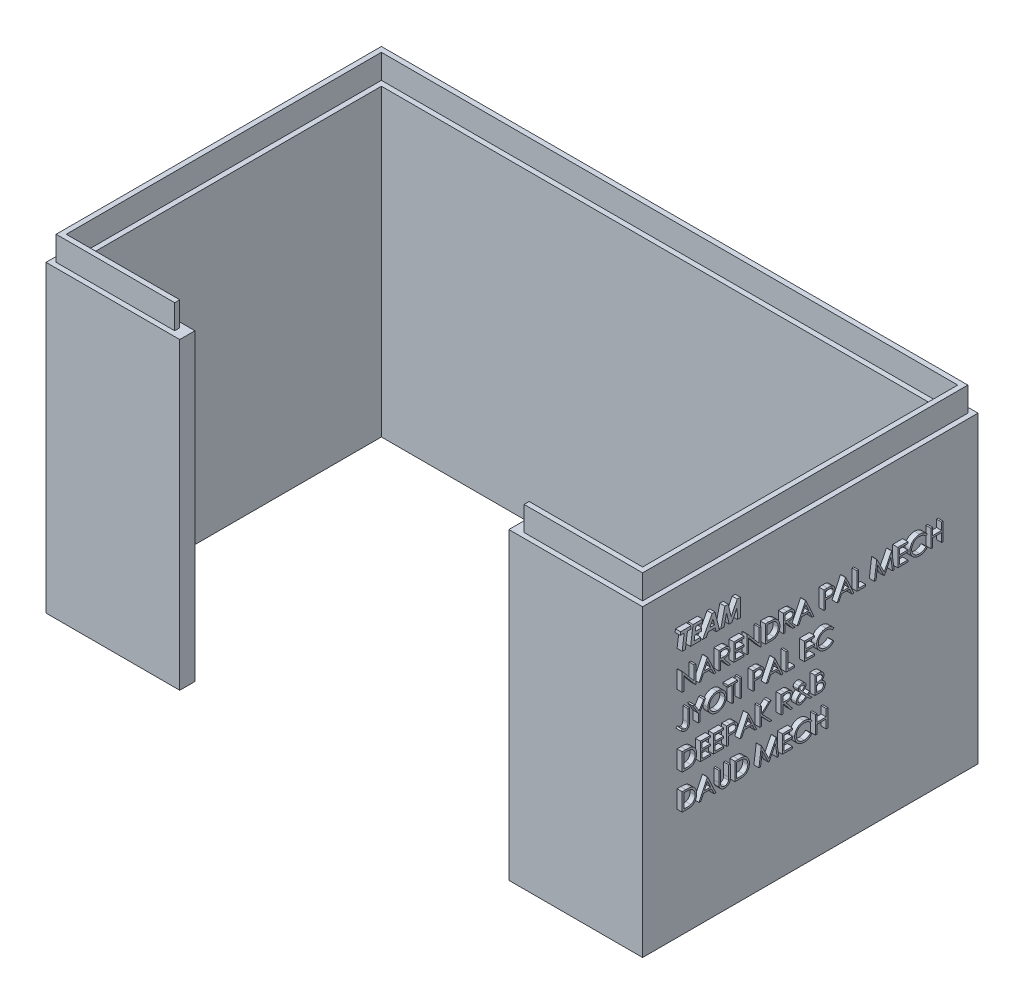
from build123d import *

# Parameters (mm, degrees)
BOSS_EXTRUDE1_DEPTH = 60
BOSS_EXTRUDE2_DEPTH = 4.8
CUT_EXTRUDE1_DEPTH  = 5
SKETCH5_W           = 0.314102564
SKETCH5_H           = 3.5
BOSS_EXTRUDE3_DEPTH = 1


with BuildPart() as part:
    # Sketch1 → Boss-Extrude1 (new body)
    with BuildSketch(Plane(origin=(0, 0, 0), x_dir=(1, 0, 0), z_dir=(0, 1, 0))):
        Polygon((-32.5, -30.12), (-32.5, -33.12), (-58.915, -33.12), (-58.915, 33.12), (58.915, 33.12), (58.915, -33.12), (32.5, -33.12), (32.5, -30.12), (55.915, -30.12), (55.915, 30.12), (-55.915, 30.12), (-55.915, -30.12), align=None)
    extrude(amount=BOSS_EXTRUDE1_DEPTH)

    # Sketch3 → Boss-Extrude2 (add)
    with BuildSketch(Plane(origin=(0, 60, 0), x_dir=(1, 0, 0), z_dir=(0, 1, 0))):
        Polygon((57.915, -32.12), (34.5, -32.12), (34.5, -31.12), (56.915, -31.12), (56.915, 31.12), (-56.915, 31.12), (-56.915, -31.12), (-34.5, -31.12), (-34.5, -32.12), (-57.915, -32.12), (-57.915, 32.12), (57.915, 32.12), align=None)
    extrude(amount=BOSS_EXTRUDE2_DEPTH)

    # Sketch4 → Cut-Extrude1 (cut)
    with BuildSketch(Plane.XZ):
        Polygon((-34.6, 32.22), (-34.6, 31.02), (-56.815, 31.02), (-56.815, -31.02), (56.815, -31.02), (56.815, 31.02), (34.6, 31.02), (34.6, 32.22), (58.015, 32.22), (58.015, -32.22), (-58.015, -32.22), (-58.015, 32.22), align=None)
    extrude(amount=-CUT_EXTRUDE1_DEPTH, mode=Mode.SUBTRACT)

    # Sketch5 → Boss-Extrude3 (add)
    # profile 1 of 46: a face of its own
    with BuildSketch(Plane(origin=(58.915, 0, 0), x_dir=(0, 0, -1), z_dir=(1, 0, 0))):
        Polygon((-26.620897161, 52.975100969), (-24.511922802, 52.975100969), (-24.587643956, 52.391767635), (-25.268433219, 52.391767635), (-25.673681616, 49.475100969), (-26.306794597, 49.475100969), (-25.902948443, 52.391767635), (-26.701526168, 52.391767635), align=None)
    # profile 2 of 46: a face of its own
    with BuildSketch(Plane(origin=(58.915, 0, 0), x_dir=(0, 0, -1), z_dir=(1, 0, 0))):
        Polygon((-24.15575293, 52.975100969), (-22.268333059, 52.975100969), (-22.341950847, 52.391767635), (-23.601866712, 52.391767635), (-23.714747321, 51.584075328), (-22.443613507, 51.584075328), (-22.517932418, 51.000741994), (-23.797479693, 51.000741994), (-23.929991712, 50.058434302), (-22.635720879, 50.058434302), (-22.710039789, 49.475100969), (-24.646538187, 49.475100969), align=None)
    # profile 3 of 46: a face of its own
    with BuildSketch(Plane(origin=(58.915, 0, 0), x_dir=(0, 0, -1), z_dir=(1, 0, 0))):
        Polygon((-20.387223283, 52.975100969), (-19.836141552, 52.975100969), (-18.947820238, 49.475100969), (-19.593553411, 49.475100969), (-19.787063027, 50.237921482), (-21.152147161, 50.237921482), (-21.561602289, 49.475100969), (-22.268333059, 49.475100969), align=None)
        Polygon((-19.936401969, 50.821254815), (-20.224563027, 51.961979975), (-20.838745719, 50.821254815), align=None, mode=Mode.SUBTRACT)
    # profile 4 of 46: a face of its own
    with BuildSketch(Plane(origin=(58.915, 0, 0), x_dir=(0, 0, -1), z_dir=(1, 0, 0))):
        Polygon((-17.870897161, 52.975100969), (-17.205532578, 52.975100969), (-16.636922802, 50.536599366), (-15.439406777, 52.975100969), (-14.81961511, 52.975100969), (-14.774743315, 49.475100969), (-15.402948443, 49.475100969), (-15.447820238, 51.568650648), (-16.475664789, 49.475100969), (-17.022539789, 49.475100969), (-17.5343587, 51.673818917), (-18.051085462, 49.475100969), (-18.694014148, 49.475100969), align=None)
    # profile 5 of 46: a face of its own
    with BuildSketch(Plane(origin=(58.915, 0, 0), x_dir=(0, 0, -1), z_dir=(1, 0, 0))):
        Polygon((-26.306794597, 42.462280456), (-26.306794597, 45.962280456), (-26.240889148, 45.962280456), (-23.928589469, 43.207572924), (-23.928589469, 45.962280456), (-23.614486905, 45.962280456), (-23.614486905, 42.462280456), (-23.686001328, 42.462280456), (-25.992692033, 45.210677892), (-25.992692033, 42.462280456), align=None)
    # profile 6 of 46: a face of its own
    with BuildSketch(Plane(origin=(58.915, 0, 0), x_dir=(0, 0, -1), z_dir=(1, 0, 0))):
        Polygon((-21.281153571, 45.962280456), (-19.665768956, 42.462280456), (-20.00721527, 42.462280456), (-20.524643155, 43.584075328), (-22.111281777, 43.584075328), (-22.642732097, 42.462280456), (-22.986281777, 42.462280456), (-21.326025366, 45.962280456), align=None)
        Polygon((-21.307095078, 45.279387828), (-21.940208059, 43.943049687), (-20.690107898, 43.943049687), align=None, mode=Mode.SUBTRACT)
    # profile 7 of 46: a face of its own
    with BuildSketch(Plane(origin=(58.915, 0, 0), x_dir=(0, 0, -1), z_dir=(1, 0, 0))):
        with BuildLine():
            Line((-19.037563828, 45.962280456), (-18.337143155, 45.962280456))
            add(Edge.make_bspline(
                [(-18.337143155, 45.962280456), (-18.290402026, 45.96212487), (-18.200653882, 45.961826128), (-18.072080611, 45.960160365), (-17.955253514, 45.955386009), (-17.850233675, 45.951277425), (-17.75702302, 45.943785484), (-17.675335729, 45.936624837), (-17.605548032, 45.927251176), (-17.563302181, 45.918545753), (-17.544174405, 45.914604174)],
                knots=[0, 0, 0, 0, 1.410062039, 2.707475311, 3.878576406, 4.937260626, 5.877586885, 6.699081471, 7.410979367, 8, 8, 8, 8], degree=3))
            add(Edge.make_bspline(
                [(-17.544174405, 45.914604174), (-17.518567781, 45.908277408), (-17.467900791, 45.895758845), (-17.394950725, 45.869299244), (-17.325436401, 45.838679619), (-17.259646577, 45.802715899), (-17.197910786, 45.761141119), (-17.139592475, 45.714672997), (-17.084427011, 45.663565791), (-17.034645381, 45.60653095), (-16.98770633, 45.54669444), (-16.948117703, 45.481990683), (-16.913991223, 45.414329156), (-16.886820706, 45.343021738), (-16.864942733, 45.268759966), (-16.849516494, 45.190871169), (-16.840265306, 45.109710194), (-16.83932345, 45.054352285), (-16.838845879, 45.02628286)],
                knots=[0, 0, 0, 0, 1.027469482, 2.033020251, 3.019912614, 3.986113645, 4.951240523, 5.91722682, 6.890402269, 7.87763091, 8.8651537, 9.85103654, 10.82876324, 11.815024772, 12.821070561, 13.842952187, 14.906261191, 16, 16, 16, 16], degree=3))
            add(Edge.make_bspline(
                [(-16.838845879, 45.02628286), (-16.840314877, 44.979647755), (-16.843181273, 44.888650587), (-16.869906377, 44.756589706), (-16.913682896, 44.633400391), (-16.974006185, 44.519237753), (-17.050825661, 44.416327108), (-17.143150452, 44.325936653), (-17.251032064, 44.25029674), (-17.35146138, 44.197843935), (-17.440175579, 44.164251027), (-17.513208892, 44.140614668), (-17.59287587, 44.122352703), (-17.678413204, 44.105992571), (-17.77017686, 44.093640876), (-17.867946899, 44.084594282), (-17.971793051, 44.078940233), (-18.04313212, 44.078098228), (-18.079831456, 44.077665071)],
                knots=[0, 0, 0, 0, 1.260483769, 2.459530307, 3.627416485, 4.787058657, 5.939039949, 7.08810263, 8.267026773, 9.491475466, 10.141966685, 10.831826277, 11.566392101, 12.351337768, 13.187381173, 14.07005841, 15.007169909, 16, 16, 16, 16], degree=3))
            Line((-18.079831456, 44.077665071), (-16.793974084, 42.462280456))
            Line((-16.793974084, 42.462280456), (-17.182395559, 42.462280456))
            Line((-17.182395559, 42.462280456), (-18.46825293, 44.077665071))
            Line((-18.46825293, 44.077665071), (-18.723461264, 44.077665071))
            Line((-18.723461264, 44.077665071), (-18.723461264, 42.462280456))
            Line((-18.723461264, 42.462280456), (-19.037563828, 42.462280456))
            Line((-19.037563828, 42.462280456), (-19.037563828, 45.962280456))
        make_face()
        with BuildLine():
            Line((-18.723461264, 45.603306097), (-18.723461264, 44.43663943))
            Line((-18.723461264, 44.43663943), (-18.082635943, 44.431731578))
            add(Edge.make_bspline(
                [(-18.082635943, 44.431731578), (-18.052715904, 44.431718341), (-17.994722347, 44.431692685), (-17.910821682, 44.435686461), (-17.832701571, 44.440229779), (-17.760660819, 44.447179125), (-17.694667243, 44.456135196), (-17.63475383, 44.467338181), (-17.580822778, 44.480390243), (-17.51792424, 44.500591869), (-17.447687708, 44.532597887), (-17.371356248, 44.579163386), (-17.306353911, 44.637732505), (-17.251436048, 44.704705961), (-17.207306617, 44.77834221), (-17.176194563, 44.857758579), (-17.15645212, 44.940950177), (-17.154123575, 44.998128285), (-17.152948443, 45.026983982)],
                knots=[0, 0, 0, 0, 1.146690395, 2.22261258, 3.21895312, 4.145990853, 4.996080663, 5.770904154, 6.481378293, 7.121626537, 8.300444488, 9.431385265, 10.535395872, 11.636531494, 12.74115979, 13.810798291, 14.895190096, 16, 16, 16, 16], degree=3))
            add(Edge.make_bspline(
                [(-17.152948443, 45.026983982), (-17.154150564, 45.055130555), (-17.15653273, 45.110906794), (-17.175981498, 45.192562704), (-17.20887088, 45.269629654), (-17.253193117, 45.341794139), (-17.307192272, 45.407299875), (-17.370510085, 45.463347028), (-17.44141528, 45.509596493), (-17.507686479, 45.539150873), (-17.566920691, 45.557270727), (-17.618350351, 45.570021891), (-17.676461829, 45.580266359), (-17.741537288, 45.58847442), (-17.813298918, 45.595529365), (-17.892109569, 45.600281143), (-17.97744635, 45.603095007), (-18.036593281, 45.603234096), (-18.067211264, 45.603306097)],
                knots=[0, 0, 0, 0, 1.101028733, 2.181837193, 3.264309656, 4.369019818, 5.486613113, 6.575447106, 7.666700264, 8.788928104, 9.402425223, 10.0903467, 10.862060571, 11.710948788, 12.657782767, 13.684531032, 14.801375019, 16, 16, 16, 16], degree=3))
            Line((-18.067211264, 45.603306097), (-18.723461264, 45.603306097))
        make_face(mode=Mode.SUBTRACT)
    # profile 8 of 46: a face of its own
    with BuildSketch(Plane(origin=(58.915, 0, 0), x_dir=(0, 0, -1), z_dir=(1, 0, 0))):
        Polygon((-16.076025366, 45.962280456), (-14.101666392, 45.962280456), (-14.101666392, 45.603306097), (-15.761922802, 45.603306097), (-15.761922802, 44.52638302), (-14.101666392, 44.52638302), (-14.101666392, 44.167408661), (-15.761922802, 44.167408661), (-15.761922802, 42.821254815), (-14.101666392, 42.821254815), (-14.101666392, 42.462280456), (-16.076025366, 42.462280456), align=None)
    # profile 9 of 46: a face of its own
    with BuildSketch(Plane(origin=(58.915, 0, 0), x_dir=(0, 0, -1), z_dir=(1, 0, 0))):
        Polygon((-13.473461264, 42.462280456), (-13.473461264, 45.962280456), (-13.407555815, 45.962280456), (-11.095256136, 43.207572924), (-11.095256136, 45.962280456), (-10.781153571, 45.962280456), (-10.781153571, 42.462280456), (-10.852667995, 42.462280456), (-13.1593587, 45.210677892), (-13.1593587, 42.462280456), align=None)
    # profile 10 of 46: a face of its own
    with BuildSketch(Plane(origin=(58.915, 0, 0), x_dir=(0, 0, -1), z_dir=(1, 0, 0))):
        with BuildLine():
            Line((-9.883717674, 42.462280456), (-9.883717674, 45.962280456))
            Line((-9.883717674, 45.962280456), (-9.176986905, 45.962280456))
            add(Edge.make_bspline(
                [(-9.176986905, 45.962280456), (-9.115517917, 45.961837886), (-8.996760151, 45.960982843), (-8.825147704, 45.955561452), (-8.666363941, 45.945970986), (-8.520931082, 45.93200146), (-8.38844987, 45.914848426), (-8.269291262, 45.893348022), (-8.162839119, 45.867959851), (-8.097369679, 45.846314401), (-8.066409982, 45.836078533)],
                knots=[0, 0, 0, 0, 1.314313732, 2.53924729, 3.670748893, 4.714932338, 5.66265055, 6.526160246, 7.303039223, 8, 8, 8, 8], degree=3))
            add(Edge.make_bspline(
                [(-8.066409982, 45.836078533), (-8.025915242, 45.820647827), (-7.94584405, 45.790136333), (-7.831836928, 45.732580032), (-7.724511565, 45.66736693), (-7.62329242, 45.594411067), (-7.530491593, 45.511646719), (-7.442483697, 45.422589633), (-7.362868973, 45.324001293), (-7.289960677, 45.217926305), (-7.224225017, 45.105614253), (-7.167085859, 44.987279144), (-7.119631866, 44.863521936), (-7.080238639, 44.734686788), (-7.049192182, 44.60049041), (-7.02801025, 44.460776544), (-7.01403926, 44.316097355), (-7.012635209, 44.217922891), (-7.011922802, 44.168109783)],
                knots=[0, 0, 0, 0, 0.984719456, 1.947108742, 2.898477687, 3.838006223, 4.779231079, 5.722358779, 6.681677486, 7.655904652, 8.64651281, 9.637519902, 10.640069247, 11.656948941, 12.698408672, 13.768548281, 14.867775369, 16, 16, 16, 16], degree=3))
            add(Edge.make_bspline(
                [(-7.011922802, 44.168109783), (-7.01255177, 44.124848544), (-7.013791216, 44.039597755), (-7.024920532, 43.91395686), (-7.041096852, 43.792043288), (-7.06614105, 43.674437588), (-7.096543563, 43.56010937), (-7.135507714, 43.450277126), (-7.18014321, 43.343933317), (-7.232193089, 43.242515841), (-7.289334474, 43.146432469), (-7.350656217, 43.05585694), (-7.416092913, 42.972081719), (-7.486268546, 42.894853107), (-7.560276262, 42.824287528), (-7.638600593, 42.759795513), (-7.721443643, 42.702638958), (-7.808434366, 42.65057185), (-7.902110495, 42.605151494), (-8.004246361, 42.566721484), (-8.115277539, 42.534874869), (-8.234931496, 42.508303973), (-8.363414974, 42.487226671), (-8.50085394, 42.473100278), (-8.64703723, 42.463547346), (-8.747416495, 42.462710952), (-8.799082257, 42.462280456)],
                knots=[0, 0, 0, 0, 1.105936401, 2.179363191, 3.223086493, 4.248585256, 5.251745608, 6.245858792, 7.225916811, 8.198733463, 9.158002045, 10.082870192, 10.993790845, 11.873723703, 12.748670949, 13.606408763, 14.465103618, 15.319838547, 16.196477973, 17.123216899, 18.106603292, 19.147568657, 20.255746949, 21.433717677, 22.679120308, 24, 24, 24, 24], degree=3))
            Line((-8.799082257, 42.462280456), (-9.883717674, 42.462280456))
        make_face()
        with BuildLine():
            Line((-9.56961511, 42.821254815), (-9.167872321, 42.821254815))
            add(Edge.make_bspline(
                [(-9.167872321, 42.821254815), (-9.110143951, 42.821502911), (-8.999111152, 42.821980091), (-8.839453155, 42.826167295), (-8.693573759, 42.833009232), (-8.561452249, 42.84258431), (-8.443163225, 42.855252925), (-8.338459475, 42.869377828), (-8.247684217, 42.886975279), (-8.19275478, 42.902926238), (-8.16737152, 42.910297283)],
                knots=[0, 0, 0, 0, 1.375205317, 2.645023457, 3.804390687, 4.853969522, 5.800190428, 6.637939096, 7.370582563, 8, 8, 8, 8], degree=3))
            add(Edge.make_bspline(
                [(-8.16737152, 42.910297283), (-8.135423158, 42.921548841), (-8.07228952, 42.943783214), (-7.981408435, 42.984340875), (-7.89665143, 43.032382945), (-7.816541405, 43.085785219), (-7.742214749, 43.146431221), (-7.672790633, 43.21300221), (-7.608408832, 43.285836985), (-7.549734524, 43.364845147), (-7.49722622, 43.449534942), (-7.45175499, 43.539073776), (-7.411903459, 43.632480586), (-7.380624866, 43.731189745), (-7.356109282, 43.834318803), (-7.338744594, 43.941875017), (-7.327929869, 44.053838298), (-7.326668421, 44.129990423), (-7.326025366, 44.168810905)],
                knots=[0, 0, 0, 0, 0.998632004, 1.973411704, 2.929992603, 3.868527914, 4.809262121, 5.754881198, 6.702106254, 7.672490631, 8.653608572, 9.636854334, 10.631411391, 11.644891563, 12.686317036, 13.754757253, 14.855430412, 16, 16, 16, 16], degree=3))
            add(Edge.make_bspline(
                [(-7.326025366, 44.168810905), (-7.326538654, 44.209744385), (-7.327547011, 44.290158569), (-7.340221322, 44.408149265), (-7.358742877, 44.521629915), (-7.385526563, 44.63060811), (-7.419657442, 44.735296463), (-7.462252084, 44.835115973), (-7.510918703, 44.931120842), (-7.56882204, 45.021095207), (-7.632237633, 45.106188317), (-7.702615513, 45.184143232), (-7.778837551, 45.255137532), (-7.860072401, 45.320276845), (-7.9486095, 45.376940521), (-8.042363191, 45.427627202), (-8.142708862, 45.470643093), (-8.212521558, 45.493521956), (-8.248000527, 45.505149046)],
                knots=[0, 0, 0, 0, 1.122418816, 2.205001699, 3.251619955, 4.274784885, 5.280384055, 6.268708349, 7.249350384, 8.229342522, 9.199999885, 10.157847722, 11.105861043, 12.055065948, 13.010012805, 13.98527497, 14.976112212, 16, 16, 16, 16], degree=3))
            add(Edge.make_bspline(
                [(-8.248000527, 45.505149046), (-8.277351673, 45.513265474), (-8.339760263, 45.530523226), (-8.441599727, 45.549348599), (-8.556214877, 45.565953098), (-8.684114578, 45.580011137), (-8.825153037, 45.590098458), (-8.979438725, 45.597669773), (-9.147038329, 45.602776405), (-9.263220863, 45.603125113), (-9.32352136, 45.603306097)],
                knots=[0, 0, 0, 0, 0.674548936, 1.434276114, 2.292660221, 3.240891867, 4.284742987, 5.42552168, 6.663806718, 8, 8, 8, 8], degree=3))
            Line((-9.32352136, 45.603306097), (-9.56961511, 45.603306097))
            Line((-9.56961511, 45.603306097), (-9.56961511, 42.821254815))
        make_face(mode=Mode.SUBTRACT)
    # profile 11 of 46: a face of its own
    with BuildSketch(Plane(origin=(58.915, 0, 0), x_dir=(0, 0, -1), z_dir=(1, 0, 0))):
        with BuildLine():
            Line((-6.293974084, 45.962280456), (-5.593553411, 45.962280456))
            add(Edge.make_bspline(
                [(-5.593553411, 45.962280456), (-5.546812283, 45.96212487), (-5.457064138, 45.961826128), (-5.328490868, 45.960160365), (-5.211663771, 45.955386009), (-5.106643932, 45.951277425), (-5.013433277, 45.943785484), (-4.931745986, 45.936624837), (-4.861958288, 45.927251176), (-4.819712437, 45.918545753), (-4.800584661, 45.914604174)],
                knots=[0, 0, 0, 0, 1.410062039, 2.707475311, 3.878576406, 4.937260626, 5.877586885, 6.699081471, 7.410979367, 8, 8, 8, 8], degree=3))
            add(Edge.make_bspline(
                [(-4.800584661, 45.914604174), (-4.774978037, 45.908277408), (-4.724311048, 45.895758845), (-4.651360982, 45.869299244), (-4.581846658, 45.838679619), (-4.516056833, 45.802715899), (-4.454321042, 45.761141119), (-4.396002731, 45.714672997), (-4.340837268, 45.663565791), (-4.291055638, 45.60653095), (-4.244116586, 45.54669444), (-4.20452796, 45.481990683), (-4.17040148, 45.414329156), (-4.143230963, 45.343021738), (-4.121352989, 45.268759966), (-4.10592675, 45.190871169), (-4.096675562, 45.109710194), (-4.095733707, 45.054352285), (-4.095256136, 45.02628286)],
                knots=[0, 0, 0, 0, 1.027469482, 2.033020251, 3.019912614, 3.986113645, 4.951240523, 5.91722682, 6.890402269, 7.87763091, 8.8651537, 9.85103654, 10.82876324, 11.815024772, 12.821070561, 13.842952187, 14.906261191, 16, 16, 16, 16], degree=3))
            add(Edge.make_bspline(
                [(-4.095256136, 45.02628286), (-4.096725134, 44.979647755), (-4.099591529, 44.888650587), (-4.126316633, 44.756589706), (-4.170093153, 44.633400391), (-4.230416442, 44.519237753), (-4.307235918, 44.416327108), (-4.399560709, 44.325936653), (-4.50744232, 44.25029674), (-4.607871636, 44.197843935), (-4.696585836, 44.164251027), (-4.769619149, 44.140614668), (-4.849286126, 44.122352703), (-4.934823461, 44.105992571), (-5.026587116, 44.093640876), (-5.124357156, 44.084594282), (-5.228203307, 44.078940233), (-5.299542377, 44.078098228), (-5.336241712, 44.077665071)],
                knots=[0, 0, 0, 0, 1.260483769, 2.459530307, 3.627416485, 4.787058657, 5.939039949, 7.08810263, 8.267026773, 9.491475466, 10.141966685, 10.831826277, 11.566392101, 12.351337768, 13.187381173, 14.07005841, 15.007169909, 16, 16, 16, 16], degree=3))
            Line((-5.336241712, 44.077665071), (-4.050384341, 42.462280456))
            Line((-4.050384341, 42.462280456), (-4.438805815, 42.462280456))
            Line((-4.438805815, 42.462280456), (-5.724663187, 44.077665071))
            Line((-5.724663187, 44.077665071), (-5.97987152, 44.077665071))
            Line((-5.97987152, 44.077665071), (-5.97987152, 42.462280456))
            Line((-5.97987152, 42.462280456), (-6.293974084, 42.462280456))
            Line((-6.293974084, 42.462280456), (-6.293974084, 45.962280456))
        make_face()
        with BuildLine():
            Line((-5.97987152, 45.603306097), (-5.97987152, 44.43663943))
            Line((-5.97987152, 44.43663943), (-5.3390462, 44.431731578))
            add(Edge.make_bspline(
                [(-5.3390462, 44.431731578), (-5.309126161, 44.431718341), (-5.251132604, 44.431692685), (-5.167231939, 44.435686461), (-5.089111827, 44.440229779), (-5.017071075, 44.447179125), (-4.9510775, 44.456135196), (-4.891164086, 44.467338181), (-4.837233034, 44.480390243), (-4.774334496, 44.500591869), (-4.704097965, 44.532597887), (-4.627766505, 44.579163386), (-4.562764167, 44.637732505), (-4.507846305, 44.704705961), (-4.463716873, 44.77834221), (-4.432604819, 44.857758579), (-4.412862377, 44.940950177), (-4.410533831, 44.998128285), (-4.4093587, 45.026983982)],
                knots=[0, 0, 0, 0, 1.146690395, 2.22261258, 3.21895312, 4.145990853, 4.996080663, 5.770904154, 6.481378293, 7.121626537, 8.300444488, 9.431385265, 10.535395872, 11.636531494, 12.74115979, 13.810798291, 14.895190096, 16, 16, 16, 16], degree=3))
            add(Edge.make_bspline(
                [(-4.4093587, 45.026983982), (-4.410560821, 45.055130555), (-4.412942986, 45.110906794), (-4.432391755, 45.192562704), (-4.465281136, 45.269629654), (-4.509603374, 45.341794139), (-4.563602529, 45.407299875), (-4.626920342, 45.463347028), (-4.697825537, 45.509596493), (-4.764096735, 45.539150873), (-4.823330948, 45.557270727), (-4.874760608, 45.570021891), (-4.932872085, 45.580266359), (-4.997947544, 45.58847442), (-5.069709175, 45.595529365), (-5.148519826, 45.600281143), (-5.233856606, 45.603095007), (-5.293003537, 45.603234096), (-5.32362152, 45.603306097)],
                knots=[0, 0, 0, 0, 1.101028733, 2.181837193, 3.264309656, 4.369019818, 5.486613113, 6.575447106, 7.666700264, 8.788928104, 9.402425223, 10.0903467, 10.862060571, 11.710948788, 12.657782767, 13.684531032, 14.801375019, 16, 16, 16, 16], degree=3))
            Line((-5.32362152, 45.603306097), (-5.97987152, 45.603306097))
        make_face(mode=Mode.SUBTRACT)
    # profile 12 of 46: a face of its own
    with BuildSketch(Plane(origin=(58.915, 0, 0), x_dir=(0, 0, -1), z_dir=(1, 0, 0))):
        Polygon((-1.896538187, 45.962280456), (-0.281153571, 42.462280456), (-0.622599886, 42.462280456), (-1.14002777, 43.584075328), (-2.726666392, 43.584075328), (-3.258116712, 42.462280456), (-3.601666392, 42.462280456), (-1.941409982, 45.962280456), align=None)
        Polygon((-1.922479693, 45.279387828), (-2.555592674, 43.943049687), (-1.305492514, 43.943049687), align=None, mode=Mode.SUBTRACT)
    # profile 13 of 46: a face of its own
    with BuildSketch(Plane(origin=(58.915, 0, 0), x_dir=(0, 0, -1), z_dir=(1, 0, 0))):
        with BuildLine():
            Line((1.693205403, 45.962280456), (2.37960364, 45.962280456))
            add(Edge.make_bspline(
                [(2.37960364, 45.962280456), (2.426814546, 45.96222856), (2.517272739, 45.962129124), (2.646987795, 45.959114378), (2.764797526, 45.955087686), (2.870447907, 45.949505793), (2.964264005, 45.942909203), (3.045821305, 45.933657163), (3.115760861, 45.923996868), (3.157667311, 45.914175461), (3.176779121, 45.909696321)],
                knots=[0, 0, 0, 0, 1.415646017, 2.712440637, 3.8905458, 4.950247383, 5.884950622, 6.709939814, 7.411656543, 8, 8, 8, 8], degree=3))
            add(Edge.make_bspline(
                [(3.176779121, 45.909696321), (3.200972655, 45.903074371), (3.248789632, 45.88998651), (3.317690675, 45.863772786), (3.38324452, 45.832690621), (3.445676079, 45.797266681), (3.504218162, 45.755981117), (3.559744203, 45.710507499), (3.611764183, 45.659795931), (3.659985575, 45.604415191), (3.704270373, 45.545294981), (3.742400055, 45.481552751), (3.774327282, 45.414261448), (3.801710554, 45.343467877), (3.821419008, 45.268577553), (3.836265908, 45.190110841), (3.845689536, 45.10807615), (3.846592097, 45.052016283), (3.847051557, 45.023478373)],
                knots=[0, 0, 0, 0, 0.999701418, 1.975846123, 2.934577507, 3.890451536, 4.834027766, 5.787354733, 6.749476667, 7.726910423, 8.712836071, 9.690891519, 10.682875813, 11.679750201, 12.712814741, 13.765529915, 14.8625177, 16, 16, 16, 16], degree=3))
            add(Edge.make_bspline(
                [(3.847051557, 45.023478373), (3.846630132, 44.994700596), (3.845805586, 44.938394932), (3.835909301, 44.856022144), (3.822579109, 44.777303754), (3.802082057, 44.702414303), (3.775236384, 44.631798533), (3.743744331, 44.564377301), (3.705760801, 44.501297629), (3.662115971, 44.442330511), (3.613564376, 44.387420599), (3.560311438, 44.336965804), (3.502572146, 44.291261466), (3.440529998, 44.250205122), (3.373580149, 44.214748843), (3.302737995, 44.182991538), (3.227387779, 44.156320477), (3.175245265, 44.142290416), (3.148734249, 44.135157058)],
                knots=[0, 0, 0, 0, 1.121902311, 2.195077645, 3.232258892, 4.234102512, 5.217864754, 6.176164875, 7.132989551, 8.084763148, 9.034132444, 9.988522005, 10.94243251, 11.903244335, 12.886203696, 13.894208494, 14.929344452, 16, 16, 16, 16], degree=3))
            add(Edge.make_bspline(
                [(3.148734249, 44.135157058), (3.126806915, 44.130494077), (3.078751888, 44.120274883), (2.999609166, 44.108866426), (2.90746378, 44.099128826), (2.8024415, 44.091827688), (2.684636595, 44.08557732), (2.553985337, 44.080609226), (2.41023126, 44.077879372), (2.309960016, 44.077738579), (2.257608448, 44.077665071)],
                knots=[0, 0, 0, 0, 0.601384939, 1.31797006, 2.144135048, 3.087295005, 4.142315834, 5.309527816, 6.595305764, 8, 8, 8, 8], degree=3))
            Line((2.257608448, 44.077665071), (2.007307967, 44.077665071))
            Line((2.007307967, 44.077665071), (2.007307967, 42.462280456))
            Line((2.007307967, 42.462280456), (1.693205403, 42.462280456))
            Line((1.693205403, 42.462280456), (1.693205403, 45.962280456))
        make_face()
        with BuildLine():
            Line((2.007307967, 45.603306097), (2.007307967, 44.43663943))
            Line((2.007307967, 44.43663943), (2.620088416, 44.428927091))
            add(Edge.make_bspline(
                [(2.620088416, 44.428927091), (2.650008342, 44.428911627), (2.707768141, 44.428881775), (2.791204365, 44.432866998), (2.868613652, 44.437467531), (2.939758227, 44.444203454), (3.004670162, 44.453724712), (3.063457691, 44.46333645), (3.115664974, 44.477241812), (3.176764175, 44.495964882), (3.244847523, 44.527897497), (3.318915071, 44.574247387), (3.381685658, 44.633328095), (3.436003955, 44.699755927), (3.479109832, 44.773655056), (3.510665825, 44.852723993), (3.529206982, 44.936151842), (3.531693176, 44.993239981), (3.532948993, 45.022076129)],
                knots=[0, 0, 0, 0, 1.160613943, 2.240541288, 3.23993089, 4.169200891, 5.011653406, 5.7853311, 6.478053781, 7.106038997, 8.262395093, 9.384106736, 10.481365981, 11.59014053, 12.70357646, 13.786202915, 14.881775077, 16, 16, 16, 16], degree=3))
            add(Edge.make_bspline(
                [(3.532948993, 45.022076129), (3.531686346, 45.050214642), (3.529176361, 45.106150525), (3.510520498, 45.188129285), (3.479171184, 45.26636499), (3.43571459, 45.339338075), (3.38297346, 45.405526879), (3.321674117, 45.463024006), (3.251960855, 45.509245709), (3.187112624, 45.53907899), (3.129511438, 45.557294266), (3.079479478, 45.570039106), (3.022988804, 45.580214712), (2.960021024, 45.588454215), (2.89106419, 45.595507676), (2.815525876, 45.600293654), (2.733692232, 45.60309511), (2.676881661, 45.603234065), (2.647432166, 45.603306097)],
                knots=[0, 0, 0, 0, 1.120700087, 2.227813068, 3.331159281, 4.466773991, 5.599788987, 6.693661531, 7.80175334, 8.91857717, 9.525282508, 10.207424825, 10.974604443, 11.810962634, 12.737642355, 13.736264703, 14.826523623, 16, 16, 16, 16], degree=3))
            Line((2.647432166, 45.603306097), (2.007307967, 45.603306097))
        make_face(mode=Mode.SUBTRACT)
    # profile 14 of 46: a face of its own
    with BuildSketch(Plane(origin=(58.915, 0, 0), x_dir=(0, 0, -1), z_dir=(1, 0, 0))):
        Polygon((6.000897711, 45.962280456), (7.616282326, 42.462280456), (7.274836012, 42.462280456), (6.757408127, 43.584075328), (5.170769505, 43.584075328), (4.639319185, 42.462280456), (4.295769505, 42.462280456), (5.956025916, 45.962280456), align=None)
        Polygon((5.974956204, 45.279387828), (5.341843223, 43.943049687), (6.591943384, 43.943049687), align=None, mode=Mode.SUBTRACT)
    # profile 15 of 46: a face of its own
    with BuildSketch(Plane(origin=(58.915, 0, 0), x_dir=(0, 0, -1), z_dir=(1, 0, 0))):
        Polygon((8.244487454, 45.962280456), (8.558590018, 45.962280456), (8.558590018, 42.821254815), (9.904743864, 42.821254815), (9.904743864, 42.462280456), (8.244487454, 42.462280456), align=None)
    # profile 16 of 46: a face of its own
    with BuildSketch(Plane(origin=(58.915, 0, 0), x_dir=(0, 0, -1), z_dir=(1, 0, 0))):
        Polygon((11.654743864, 42.462280456), (12.116783127, 45.962280456), (12.161654922, 45.962280456), (13.606666941, 43.090485584), (15.04747223, 45.962280456), (15.092344025, 45.962280456), (15.558590018, 42.462280456), (15.244487454, 42.462280456), (14.907948993, 44.978606578), (13.64522864, 42.462280456), (13.573714217, 42.462280456), (12.30538489, 44.986318917), (11.970949794, 42.462280456), align=None)
    # profile 17 of 46: a face of its own
    with BuildSketch(Plane(origin=(58.915, 0, 0), x_dir=(0, 0, -1), z_dir=(1, 0, 0))):
        Polygon((16.276538736, 45.962280456), (18.250897711, 45.962280456), (18.250897711, 45.603306097), (16.5906413, 45.603306097), (16.5906413, 44.52638302), (18.250897711, 44.52638302), (18.250897711, 44.167408661), (16.5906413, 44.167408661), (16.5906413, 42.821254815), (18.250897711, 42.821254815), (18.250897711, 42.462280456), (16.276538736, 42.462280456), align=None)
    # profile 18 of 46: a face of its own
    with BuildSketch(Plane(origin=(58.915, 0, 0), x_dir=(0, 0, -1), z_dir=(1, 0, 0))):
        with BuildLine():
            Line((22.10987207, 45.320052892), (21.835032326, 45.109716353))
            add(Edge.make_bspline(
                [(21.835032326, 45.109716353), (21.815426438, 45.133082323), (21.776478991, 45.179499239), (21.713819788, 45.244678783), (21.648518145, 45.305744045), (21.580599024, 45.362985924), (21.508839905, 45.41440269), (21.434979106, 45.462673793), (21.357781061, 45.505941531), (21.251029326, 45.558404517), (21.111381478, 45.613150672), (20.935586639, 45.659053903), (20.75207554, 45.688275079), (20.626877941, 45.691439921), (20.56319739, 45.693049687)],
                knots=[0, 0, 0, 0, 0.757959112, 1.505699292, 2.245454638, 2.979532153, 3.711538275, 4.438200793, 5.171680507, 5.909471876, 7.393775596, 8.890124382, 10.418191784, 12, 12, 12, 12], degree=3))
            add(Edge.make_bspline(
                [(20.56319739, 45.693049687), (20.528114091, 45.692645724), (20.458273098, 45.691841548), (20.354624625, 45.681232423), (20.252911574, 45.666321213), (20.153200107, 45.64419589), (20.055617149, 45.616223271), (19.959524747, 45.582797857), (19.866314147, 45.541443017), (19.774695909, 45.495734757), (19.686916698, 45.444107312), (19.60386165, 45.38779396), (19.525833682, 45.327424864), (19.45277107, 45.262773758), (19.384599122, 45.194131797), (19.321811811, 45.120767455), (19.2646264, 45.042915282), (19.211909375, 44.961601874), (19.164696642, 44.877064083), (19.125166763, 44.788989012), (19.09016164, 44.698884909), (19.062462398, 44.605733748), (19.040537881, 44.510190983), (19.025410218, 44.412000195), (19.014921747, 44.311366515), (19.01412157, 44.243157202), (19.013718223, 44.208774847)],
                knots=[0, 0, 0, 0, 1.054917814, 2.100044995, 3.131103042, 4.146048494, 5.169673617, 6.183595914, 7.203665975, 8.234915748, 9.262203917, 10.264457458, 11.251630812, 12.227803204, 13.197192746, 14.159520551, 15.12972552, 16.100847026, 17.073214652, 18.039054194, 19.002613845, 19.979014051, 20.95965708, 21.949030935, 22.966165397, 24, 24, 24, 24], degree=3))
            add(Edge.make_bspline(
                [(19.013718223, 44.208774847), (19.014980042, 44.157043527), (19.017457457, 44.055475942), (19.039505791, 43.906705332), (19.073010882, 43.764184658), (19.123226459, 43.628804816), (19.18514551, 43.498896457), (19.263386121, 43.376657604), (19.354002658, 43.26024104), (19.458277078, 43.152398092), (19.572682894, 43.053884366), (19.695430806, 42.967133785), (19.826215093, 42.894818903), (19.963591723, 42.834642956), (20.108617837, 42.788386228), (20.26103264, 42.755822105), (20.420504635, 42.734579924), (20.529474035, 42.732546236), (20.584932166, 42.731511225)],
                knots=[0, 0, 0, 0, 1.029171465, 2.020641659, 2.987623507, 3.938342917, 4.889210282, 5.84687017, 6.821220943, 7.821438502, 8.827599549, 9.822697543, 10.807740252, 11.797342354, 12.80366471, 13.83203677, 14.896651826, 16, 16, 16, 16], degree=3))
            add(Edge.make_bspline(
                [(20.584932166, 42.731511225), (20.646034855, 42.733200005), (20.766299564, 42.736523927), (20.94266759, 42.764683177), (21.111503356, 42.810341094), (21.272815942, 42.874239017), (21.426150588, 42.957304305), (21.571747249, 43.058002182), (21.709728819, 43.177290515), (21.792700101, 43.268373643), (21.835032326, 43.314844558)],
                knots=[0, 0, 0, 0, 1.028121516, 2.023589091, 2.998037872, 3.967518031, 4.937445131, 5.927275754, 6.942489185, 8, 8, 8, 8], degree=3))
            Line((21.835032326, 43.314844558), (22.10987207, 43.106611385))
            add(Edge.make_bspline(
                [(22.10987207, 43.106611385), (22.08775396, 43.078072933), (22.043623684, 43.021132727), (21.972165667, 42.940861017), (21.89688837, 42.865356982), (21.81723266, 42.795229361), (21.734114868, 42.729074895), (21.646042556, 42.668773064), (21.554173524, 42.61348218), (21.458819045, 42.562855255), (21.360080432, 42.517938008), (21.258075997, 42.47948424), (21.153245421, 42.446359351), (21.045583913, 42.419107414), (20.934868156, 42.39783633), (20.821497682, 42.383616655), (20.705227807, 42.373874741), (20.626786386, 42.372986825), (20.587035531, 42.372536866)],
                knots=[0, 0, 0, 0, 0.986787822, 1.968848986, 2.935600012, 3.899624008, 4.868462664, 5.837806735, 6.815139263, 7.798259679, 8.787526145, 9.778297419, 10.776456485, 11.791383307, 12.812564526, 13.85620153, 14.913611965, 16, 16, 16, 16], degree=3))
            add(Edge.make_bspline(
                [(20.587035531, 42.372536866), (20.549391864, 42.372798859), (20.474956174, 42.373316917), (20.365057422, 42.381709084), (20.258067842, 42.393158821), (20.154293216, 42.410398952), (20.053167241, 42.430743292), (19.955606656, 42.458014549), (19.860651446, 42.488563715), (19.768683105, 42.524468702), (19.679623405, 42.564984884), (19.593759594, 42.610776443), (19.511131162, 42.661458308), (19.430925741, 42.715913318), (19.354328157, 42.77589062), (19.280674632, 42.840557255), (19.209552155, 42.909695266), (19.16554947, 42.959550119), (19.143425755, 42.984616193)],
                knots=[0, 0, 0, 0, 1.114604814, 2.203992996, 3.262667896, 4.300477797, 5.318619304, 6.316056647, 7.298880507, 8.271930387, 9.238335007, 10.195173496, 11.151986948, 12.108099108, 13.064862484, 14.031167946, 15.010108607, 16, 16, 16, 16], degree=3))
            add(Edge.make_bspline(
                [(19.143425755, 42.984616193), (19.107990112, 43.028157382), (19.037546635, 43.114714092), (18.947420952, 43.255000074), (18.870273396, 43.401468283), (18.807897476, 43.554888211), (18.759134742, 43.714915599), (18.725353547, 43.881631113), (18.703401943, 44.054879055), (18.700891654, 44.172715844), (18.699615659, 44.232612988)],
                knots=[0, 0, 0, 0, 0.994628077, 1.977248131, 2.950237994, 3.925870899, 4.908910175, 5.911660606, 6.938484602, 8, 8, 8, 8], degree=3))
            add(Edge.make_bspline(
                [(18.699615659, 44.232612988), (18.701170853, 44.295568441), (18.704230599, 44.419429366), (18.730226395, 44.601203319), (18.772045191, 44.775354718), (18.831442079, 44.941558463), (18.906747431, 45.100688743), (18.999774045, 45.251529948), (19.109441187, 45.395046748), (19.234888754, 45.529061499), (19.37245609, 45.651600851), (19.519774904, 45.759407055), (19.676556851, 45.849124571), (19.841074702, 45.924120734), (20.014560384, 45.981765197), (20.196643753, 46.022118383), (20.386982668, 46.0472355), (20.516845093, 46.050410708), (20.5828288, 46.052024046)],
                knots=[0, 0, 0, 0, 1.032925535, 2.032216505, 3.007276963, 3.968222605, 4.92396291, 5.891752235, 6.871517503, 7.883894988, 8.900124299, 9.891468569, 10.874487609, 11.85992873, 12.854644235, 13.869047385, 14.917252991, 16, 16, 16, 16], degree=3))
            add(Edge.make_bspline(
                [(20.5828288, 46.052024046), (20.623043272, 46.051541907), (20.70264377, 46.050587563), (20.820396422, 46.041281421), (20.935038749, 46.025767815), (21.046649731, 46.004651745), (21.155772347, 45.978444424), (21.261572588, 45.944304126), (21.364671275, 45.905267594), (21.464418183, 45.860309128), (21.560334733, 45.809842387), (21.652391052, 45.754426763), (21.73985591, 45.694130958), (21.823344759, 45.629467782), (21.90146097, 45.559069223), (21.976422449, 45.484871627), (22.045683527, 45.404737803), (22.088436722, 45.348332869), (22.10987207, 45.320052892)],
                knots=[0, 0, 0, 0, 1.096760587, 2.17092713, 3.219439832, 4.250915756, 5.268269357, 6.278326846, 7.281116186, 8.274029601, 9.260640565, 10.235837813, 11.203064059, 12.156899882, 13.114053108, 14.069676657, 15.032185724, 16, 16, 16, 16], degree=3))
        make_face()
    # profile 19 of 46: a face of its own
    with BuildSketch(Plane(origin=(58.915, 0, 0), x_dir=(0, 0, -1), z_dir=(1, 0, 0))):
        Polygon((22.827820788, 45.962280456), (23.141923352, 45.962280456), (23.141923352, 44.52638302), (24.936795147, 44.52638302), (24.936795147, 45.962280456), (25.250897711, 45.962280456), (25.250897711, 42.462280456), (24.936795147, 42.462280456), (24.936795147, 44.167408661), (23.141923352, 44.167408661), (23.141923352, 42.462280456), (22.827820788, 42.462280456), align=None)
    # profile 20 of 46: a face of its own
    with BuildSketch(Plane(origin=(58.915, 0, 0), x_dir=(0, 0, -1), z_dir=(1, 0, 0))):
        with BuildLine():
            Line((-25.184999725, 39.128947123), (-24.870897161, 39.128947123))
            Line((-24.870897161, 39.128947123), (-24.870897161, 36.765465552))
            add(Edge.make_bspline(
                [(-24.870897161, 36.765465552), (-24.87121108, 36.721760381), (-24.871813842, 36.63784112), (-24.875128252, 36.516967224), (-24.88126173, 36.406596538), (-24.890196743, 36.306478091), (-24.902116976, 36.216925536), (-24.915758004, 36.137246918), (-24.932270803, 36.068107235), (-24.957137269, 35.99047188), (-24.997911217, 35.905328075), (-25.059278256, 35.813372924), (-25.135511052, 35.732939514), (-25.223812085, 35.663086789), (-25.324953109, 35.607429558), (-25.436851328, 35.567474379), (-25.558817916, 35.543103523), (-25.643417128, 35.540529617), (-25.68700293, 35.539203533)],
                knots=[0, 0, 0, 0, 1.237770943, 2.376671248, 3.424123796, 4.367912054, 5.222547132, 5.982086412, 6.656319012, 7.234008312, 8.288027371, 9.317870876, 10.352700517, 11.413286737, 12.494591526, 13.606319346, 14.766767577, 16, 16, 16, 16], degree=3))
            add(Edge.make_bspline(
                [(-25.68700293, 35.539203533), (-25.720961289, 35.540284142), (-25.789287755, 35.542458399), (-25.890978463, 35.560180112), (-25.992380439, 35.587496155), (-26.094031888, 35.627498751), (-26.197941129, 35.681904349), (-26.305515476, 35.753089166), (-26.418138667, 35.840920692), (-26.492321953, 35.907958438), (-26.531153571, 35.943049687)],
                knots=[0, 0, 0, 0, 0.848567217, 1.707373443, 2.573483905, 3.470863513, 4.432650262, 5.500696352, 6.691726801, 8, 8, 8, 8], degree=3))
            Line((-26.531153571, 35.943049687), (-26.346057418, 36.212280456))
            add(Edge.make_bspline(
                [(-26.346057418, 36.212280456), (-26.303354739, 36.18283306), (-26.222726512, 36.127232536), (-26.104222072, 36.055705936), (-25.999224919, 35.99438077), (-25.930541971, 35.963128491), (-25.898741712, 35.948658661)],
                knots=[0, 0, 0, 0, 1.196737151, 2.259595785, 3.194191475, 4, 4, 4, 4], degree=3))
            add(Edge.make_bspline(
                [(-25.898741712, 35.948658661), (-25.879457401, 35.941099204), (-25.841636572, 35.926273424), (-25.783811492, 35.909727526), (-25.726316455, 35.900685116), (-25.688198761, 35.899003783), (-25.669474886, 35.898177892)],
                knots=[0, 0, 0, 0, 1.051806502, 2.062826769, 3.048436908, 4, 4, 4, 4], degree=3))
            add(Edge.make_bspline(
                [(-25.669474886, 35.898177892), (-25.645292097, 35.899200627), (-25.597491641, 35.901222197), (-25.528027647, 35.919071472), (-25.461569616, 35.946315875), (-25.400499958, 35.986207169), (-25.344214571, 36.033638589), (-25.297771745, 36.090994598), (-25.259054501, 36.154560582), (-25.235754807, 36.214732036), (-25.220910035, 36.269608666), (-25.211488409, 36.320041802), (-25.203249748, 36.379003281), (-25.196068196, 36.446563481), (-25.191863726, 36.522857663), (-25.187146453, 36.607661806), (-25.185441192, 36.701189718), (-25.185151371, 36.76640067), (-25.184999725, 36.800521642)],
                knots=[0, 0, 0, 0, 0.997221856, 1.971139923, 2.944579524, 3.951425367, 4.971190333, 5.972282193, 6.985401279, 8.033996657, 8.624075553, 9.332086008, 10.151144245, 11.082816738, 12.137127781, 13.306538797, 14.590673636, 16, 16, 16, 16], degree=3))
            Line((-25.184999725, 36.800521642), (-25.184999725, 39.128947123))
        make_face()
    # profile 21 of 46: a face of its own
    with BuildSketch(Plane(origin=(58.915, 0, 0), x_dir=(0, 0, -1), z_dir=(1, 0, 0))):
        Polygon((-24.242692033, 39.128947123), (-23.883016552, 39.128947123), (-22.964547001, 37.626443116), (-22.045376328, 39.128947123), (-21.684999725, 39.128947123), (-22.806794597, 37.292709142), (-22.806794597, 35.628947123), (-23.120897161, 35.628947123), (-23.120897161, 37.292709142), align=None)
    # profile 22 of 46: a face of its own
    with BuildSketch(Plane(origin=(58.915, 0, 0), x_dir=(0, 0, -1), z_dir=(1, 0, 0))):
        with BuildLine():
            add(Edge.make_bspline(
                [(-19.418974084, 39.218690712), (-19.354165978, 39.217049233), (-19.226877511, 39.213825232), (-19.039802614, 39.189146128), (-18.861207518, 39.146450738), (-18.68963738, 39.089587756), (-18.527144403, 39.013733371), (-18.372505511, 38.922048222), (-18.226088637, 38.813571764), (-18.089867255, 38.689142537), (-17.965210305, 38.553759083), (-17.855384419, 38.409281173), (-17.763342125, 38.25658237), (-17.687756338, 38.09612154), (-17.628457728, 37.928261572), (-17.587538684, 37.752107569), (-17.561400534, 37.568800879), (-17.558344757, 37.443774014), (-17.556794597, 37.380349366)],
                knots=[0, 0, 0, 0, 1.065120563, 2.091984664, 3.0946048, 4.079830382, 5.057816894, 6.036188127, 7.030412546, 8.04752943, 9.064399622, 10.05169764, 11.02544977, 11.989514704, 12.962713494, 13.945757189, 14.957906945, 16, 16, 16, 16], degree=3))
            add(Edge.make_bspline(
                [(-17.556794597, 37.380349366), (-17.55834453, 37.31739192), (-17.561399626, 37.193295499), (-17.587568404, 37.011152055), (-17.628609404, 36.836061359), (-17.68720567, 36.668315706), (-17.762431148, 36.507738142), (-17.855086319, 36.354751188), (-17.96422753, 36.20930469), (-18.088434381, 36.072992025), (-18.223835423, 35.947994554), (-18.36906569, 35.839075678), (-18.52085901, 35.745351554), (-18.681168718, 35.67056788), (-18.847868755, 35.610795959), (-19.022451078, 35.570043329), (-19.204097632, 35.543756286), (-19.327968636, 35.54073777), (-19.390929212, 35.539203533)],
                knots=[0, 0, 0, 0, 1.043624062, 2.057103931, 3.04512605, 4.022047818, 4.998200453, 5.980619268, 6.982898556, 8.009068085, 9.034988726, 10.034168286, 11.015286542, 11.987931943, 12.962482838, 13.94673481, 14.956375938, 16, 16, 16, 16], degree=3))
            add(Edge.make_bspline(
                [(-19.390929212, 35.539203533), (-19.454353531, 35.54075292), (-19.579379747, 35.543807174), (-19.762916783, 35.569988578), (-19.939194527, 35.610929882), (-20.107708878, 35.669439318), (-20.268553807, 35.745056549), (-20.42204389, 35.837260928), (-20.567563037, 35.946668069), (-20.703904784, 36.070834644), (-20.828653982, 36.206006196), (-20.937413358, 36.350840451), (-21.029638471, 36.502495908), (-21.105001804, 36.661393432), (-21.164666263, 36.826764875), (-21.205371081, 36.999713352), (-21.231707033, 37.179252858), (-21.23474188, 37.301495756), (-21.236281777, 37.363522443)],
                knots=[0, 0, 0, 0, 1.053102029, 2.075944431, 3.073151272, 4.055350789, 5.033113405, 6.020478099, 7.024410459, 8.052272461, 9.079885166, 10.07527673, 11.055994387, 12.023226415, 12.992069828, 13.970394897, 14.97016774, 16, 16, 16, 16], degree=3))
            add(Edge.make_bspline(
                [(-21.236281777, 37.363522443), (-21.235747141, 37.405155112), (-21.234684615, 37.487895236), (-21.221892922, 37.610761836), (-21.203331221, 37.731652494), (-21.176729308, 37.850223442), (-21.141937642, 37.966184426), (-21.100885614, 38.080335189), (-21.050745769, 38.191518913), (-20.994065121, 38.300262305), (-20.930803313, 38.40487021), (-20.860927563, 38.503749794), (-20.786892195, 38.59773079), (-20.705728801, 38.684377794), (-20.620112356, 38.766211451), (-20.528653978, 38.841974168), (-20.431911733, 38.912349119), (-20.329469354, 38.97576946), (-20.223851079, 39.033128594), (-20.114974301, 39.082350445), (-20.00431773, 39.124596507), (-19.891363082, 39.158837332), (-19.77641031, 39.185869368), (-19.659208525, 39.204276722), (-19.539851099, 39.21710104), (-19.45943978, 39.218158542), (-19.418974084, 39.218690712)],
                knots=[0, 0, 0, 0, 1.037015668, 2.060948919, 3.074880161, 4.083647147, 5.086022904, 6.090072063, 7.104153813, 8.122640571, 9.144368836, 10.147691507, 11.138137339, 12.123020368, 13.103399296, 14.087645067, 15.080126199, 16.082011238, 17.087798457, 18.072939717, 19.057185487, 20.037253025, 21.01195951, 21.997135196, 22.992090687, 24, 24, 24, 24], degree=3))
        make_face()
        with BuildLine():
            add(Edge.make_bspline(
                [(-19.403549405, 38.859716353), (-19.436764038, 38.859311463), (-19.502875771, 38.858505553), (-19.601160307, 38.847889838), (-19.698152241, 38.832759949), (-19.793871603, 38.811178428), (-19.887917893, 38.781774375), (-19.981167734, 38.747933467), (-20.072770788, 38.706712376), (-20.162424646, 38.660139672), (-20.249339721, 38.608590751), (-20.331352422, 38.551618984), (-20.408675066, 38.49056043), (-20.481118333, 38.425272593), (-20.548469505, 38.355422991), (-20.612054207, 38.282070555), (-20.669323788, 38.203118664), (-20.721809365, 38.120708257), (-20.768777205, 38.034946676), (-20.81054256, 37.946736813), (-20.844706569, 37.855359127), (-20.872568945, 37.761804969), (-20.895668756, 37.666222509), (-20.91030268, 37.56788666), (-20.92103504, 37.467291548), (-20.921794885, 37.399309694), (-20.922179212, 37.364924687)],
                knots=[0, 0, 0, 0, 1.008559885, 2.007477868, 2.99961109, 3.989939068, 4.984837346, 5.991145699, 7.001802488, 8.033829008, 9.059044045, 10.069351652, 11.065060232, 12.050310815, 13.029377138, 14.011219647, 14.996725999, 15.989392538, 16.977580475, 17.965360261, 18.951710183, 19.937753436, 20.929683414, 21.935841486, 22.955955122, 24, 24, 24, 24], degree=3))
            add(Edge.make_bspline(
                [(-20.922179212, 37.364924687), (-20.920904351, 37.314362466), (-20.918396303, 37.214890936), (-20.896438733, 37.069122792), (-20.862616758, 36.929034505), (-20.812759392, 36.795392596), (-20.750408777, 36.667048313), (-20.673381887, 36.545140209), (-20.582122801, 36.429635334), (-20.478459275, 36.321340065), (-20.365136568, 36.222494261), (-20.244803838, 36.135730852), (-20.118750231, 36.062320603), (-19.986647028, 36.00251553), (-19.849199489, 35.955125792), (-19.705521938, 35.922647161), (-19.556571478, 35.901271706), (-19.455040823, 35.89921895), (-19.403549405, 35.898177892)],
                knots=[0, 0, 0, 0, 1.032063989, 2.030389145, 3.003944642, 3.970395727, 4.937377036, 5.913328081, 6.909231446, 7.93887556, 8.970685674, 9.976071282, 10.964166581, 11.944589148, 12.933237628, 13.927779006, 14.949070134, 16, 16, 16, 16], degree=3))
            add(Edge.make_bspline(
                [(-19.403549405, 35.898177892), (-19.368939903, 35.898653396), (-19.300298867, 35.899596464), (-19.198203344, 35.909095141), (-19.097947133, 35.92432701), (-18.999670853, 35.946257666), (-18.903486041, 35.973704872), (-18.808991238, 36.0063126), (-18.717192948, 36.046993804), (-18.62693311, 36.091941756), (-18.540536869, 36.143181913), (-18.458061336, 36.198220063), (-18.381585356, 36.259188684), (-18.309196285, 36.323506496), (-18.241568596, 36.392470344), (-18.179159612, 36.465990566), (-18.12217948, 36.544531223), (-18.069713833, 36.626816629), (-18.02291057, 36.712812881), (-17.982131471, 36.801342559), (-17.947535355, 36.892187669), (-17.91960685, 36.98547924), (-17.897721389, 37.081040089), (-17.882641469, 37.178998167), (-17.87209303, 37.27915751), (-17.871297953, 37.346901366), (-17.870897161, 37.381050488)],
                knots=[0, 0, 0, 0, 1.047197238, 2.076906641, 3.100256066, 4.114471768, 5.12198147, 6.126382909, 7.136867548, 8.15857795, 9.17633901, 10.174870724, 11.156907918, 12.133735059, 13.104061851, 14.077631395, 15.04955518, 16.038496417, 17.029181396, 18.010275684, 18.986308667, 19.968651475, 20.955262928, 21.950658345, 22.966943676, 24, 24, 24, 24], degree=3))
            add(Edge.make_bspline(
                [(-17.870897161, 37.381050488), (-17.871298274, 37.414965992), (-17.872093956, 37.482243642), (-17.88263643, 37.581704461), (-17.897737321, 37.678957672), (-17.919500029, 37.773621475), (-17.947550182, 37.86572), (-17.982137513, 37.955166748), (-18.022922812, 38.042294943), (-18.069731037, 38.12688924), (-18.12234686, 38.208063978), (-18.179841103, 38.285666391), (-18.243206452, 38.358239132), (-18.310632476, 38.427573826), (-18.383803362, 38.492191716), (-18.462387656, 38.552114236), (-18.545431334, 38.60878751), (-18.633358569, 38.659913072), (-18.724102523, 38.707127305), (-18.817216481, 38.747578308), (-18.91164558, 38.781950428), (-19.007149693, 38.811267393), (-19.104532671, 38.832675423), (-19.2031365, 38.847903473), (-19.302824758, 38.858501859), (-19.369867978, 38.859310237), (-19.403549405, 38.859716353)],
                knots=[0, 0, 0, 0, 1.02996197, 2.043119294, 3.035359645, 4.018872909, 4.991431989, 5.957985074, 6.929999688, 7.912076566, 8.892894881, 9.867085534, 10.843653904, 11.817741046, 12.803660682, 13.806313499, 14.818574707, 15.856120519, 16.894564902, 17.924820532, 18.937903209, 19.946497019, 20.957711757, 21.963978472, 22.977135795, 24, 24, 24, 24], degree=3))
        make_face(mode=Mode.SUBTRACT)
    # profile 23 of 46: a face of its own
    with BuildSketch(Plane(origin=(58.915, 0, 0), x_dir=(0, 0, -1), z_dir=(1, 0, 0))):
        Polygon((-17.242692033, 38.769972764), (-17.242692033, 39.128947123), (-15.402948443, 39.128947123), (-15.402948443, 38.769972764), (-16.165768956, 38.769972764), (-16.165768956, 35.628947123), (-16.47987152, 35.628947123), (-16.47987152, 38.769972764), align=None)
    # profile 24 of 46: a face of its own
    with BuildSketch(Plane(origin=(58.915, 0, 0), x_dir=(0, 0, -1), z_dir=(1, 0, 0))):
        with Locations((-14.707435623, 37.378947123)):
            Rectangle(SKETCH5_W, SKETCH5_H)
    # profile 25 of 46: a face of its own
    with BuildSketch(Plane(origin=(58.915, 0, 0), x_dir=(0, 0, -1), z_dir=(1, 0, 0))):
        with BuildLine():
            Line((-12.306794597, 39.128947123), (-11.62039636, 39.128947123))
            add(Edge.make_bspline(
                [(-11.62039636, 39.128947123), (-11.573185454, 39.128895226), (-11.482727261, 39.128795791), (-11.353012205, 39.125781045), (-11.235202474, 39.121754353), (-11.129552093, 39.11617246), (-11.035735995, 39.109575869), (-10.954178695, 39.10032383), (-10.884239139, 39.090663535), (-10.842332689, 39.080842128), (-10.823220879, 39.076362988)],
                knots=[0, 0, 0, 0, 1.415646017, 2.712440637, 3.8905458, 4.950247383, 5.884950622, 6.709939814, 7.411656543, 8, 8, 8, 8], degree=3))
            add(Edge.make_bspline(
                [(-10.823220879, 39.076362988), (-10.799027345, 39.069741038), (-10.751210368, 39.056653176), (-10.682309325, 39.030439453), (-10.61675548, 38.999357288), (-10.554323921, 38.963933348), (-10.495781838, 38.922647784), (-10.440255797, 38.877174166), (-10.388235817, 38.826462597), (-10.340014425, 38.771081858), (-10.295729627, 38.711961648), (-10.257599945, 38.648219418), (-10.225672718, 38.580928114), (-10.198289446, 38.510134543), (-10.178580992, 38.43524422), (-10.163734092, 38.356777507), (-10.154310464, 38.274742817), (-10.153407903, 38.21868295), (-10.152948443, 38.190145039)],
                knots=[0, 0, 0, 0, 0.999701418, 1.975846123, 2.934577507, 3.890451536, 4.834027766, 5.787354733, 6.749476667, 7.726910423, 8.712836071, 9.690891519, 10.682875813, 11.679750201, 12.712814741, 13.765529915, 14.8625177, 16, 16, 16, 16], degree=3))
            add(Edge.make_bspline(
                [(-10.152948443, 38.190145039), (-10.153369868, 38.161367262), (-10.154194414, 38.105061598), (-10.164090699, 38.02268881), (-10.177420891, 37.94397042), (-10.197917943, 37.86908097), (-10.224763616, 37.798465199), (-10.256255669, 37.731043967), (-10.294239199, 37.667964295), (-10.337884029, 37.608997178), (-10.386435624, 37.554087265), (-10.439688562, 37.503632471), (-10.497427854, 37.457928133), (-10.559470002, 37.416871789), (-10.626419851, 37.381415509), (-10.697262005, 37.349658204), (-10.772612221, 37.322987144), (-10.824754735, 37.308957082), (-10.851265751, 37.301823725)],
                knots=[0, 0, 0, 0, 1.121902311, 2.195077645, 3.232258892, 4.234102512, 5.217864754, 6.176164875, 7.132989551, 8.084763148, 9.034132444, 9.988522005, 10.94243251, 11.903244335, 12.886203696, 13.894208494, 14.929344452, 16, 16, 16, 16], degree=3))
            add(Edge.make_bspline(
                [(-10.851265751, 37.301823725), (-10.873193085, 37.297160744), (-10.921248112, 37.28694155), (-11.000390834, 37.275533093), (-11.09253622, 37.265795492), (-11.1975585, 37.258494355), (-11.315363405, 37.252243986), (-11.446014663, 37.247275892), (-11.58976874, 37.244546039), (-11.690039984, 37.244405246), (-11.742391552, 37.244331738)],
                knots=[0, 0, 0, 0, 0.601384939, 1.31797006, 2.144135048, 3.087295005, 4.142315834, 5.309527816, 6.595305764, 8, 8, 8, 8], degree=3))
            Line((-11.742391552, 37.244331738), (-11.992692033, 37.244331738))
            Line((-11.992692033, 37.244331738), (-11.992692033, 35.628947123))
            Line((-11.992692033, 35.628947123), (-12.306794597, 35.628947123))
            Line((-12.306794597, 35.628947123), (-12.306794597, 39.128947123))
        make_face()
        with BuildLine():
            Line((-11.992692033, 38.769972764), (-11.992692033, 37.603306097))
            Line((-11.992692033, 37.603306097), (-11.379911584, 37.595593757))
            add(Edge.make_bspline(
                [(-11.379911584, 37.595593757), (-11.349991658, 37.595578294), (-11.292231859, 37.595548441), (-11.208795635, 37.599533665), (-11.131386348, 37.604134198), (-11.060241773, 37.610870121), (-10.995329838, 37.620391379), (-10.936542309, 37.630003116), (-10.884335026, 37.643908479), (-10.823235825, 37.662631548), (-10.755152477, 37.694564164), (-10.681084929, 37.740914054), (-10.618314342, 37.799994762), (-10.563996045, 37.866422593), (-10.520890168, 37.940321723), (-10.489334175, 38.01939066), (-10.470793018, 38.102818509), (-10.468306824, 38.159906648), (-10.467051007, 38.188742796)],
                knots=[0, 0, 0, 0, 1.160613943, 2.240541288, 3.23993089, 4.169200891, 5.011653406, 5.7853311, 6.478053781, 7.106038997, 8.262395093, 9.384106736, 10.481365981, 11.59014053, 12.70357646, 13.786202915, 14.881775077, 16, 16, 16, 16], degree=3))
            add(Edge.make_bspline(
                [(-10.467051007, 38.188742796), (-10.468313654, 38.216881309), (-10.470823639, 38.272817191), (-10.489479502, 38.354795952), (-10.520828816, 38.433031656), (-10.56428541, 38.506004742), (-10.61702654, 38.572193546), (-10.678325883, 38.629690673), (-10.748039145, 38.675912375), (-10.812887376, 38.705745657), (-10.870488562, 38.723960932), (-10.920520522, 38.736705773), (-10.977011196, 38.746881379), (-11.039978976, 38.755120882), (-11.10893581, 38.762174343), (-11.184474124, 38.76696032), (-11.266307768, 38.769761777), (-11.323118339, 38.769900732), (-11.352567834, 38.769972764)],
                knots=[0, 0, 0, 0, 1.120700087, 2.227813068, 3.331159281, 4.466773991, 5.599788987, 6.693661531, 7.80175334, 8.91857717, 9.525282508, 10.207424825, 10.974604443, 11.810962634, 12.737642355, 13.736264703, 14.826523623, 16, 16, 16, 16], degree=3))
            Line((-11.352567834, 38.769972764), (-11.992692033, 38.769972764))
        make_face(mode=Mode.SUBTRACT)
    # profile 26 of 46: a face of its own
    with BuildSketch(Plane(origin=(58.915, 0, 0), x_dir=(0, 0, -1), z_dir=(1, 0, 0))):
        Polygon((-7.999102289, 39.128947123), (-6.383717674, 35.628947123), (-6.725163988, 35.628947123), (-7.242591873, 36.750741994), (-8.829230495, 36.750741994), (-9.360680815, 35.628947123), (-9.704230495, 35.628947123), (-8.043974084, 39.128947123), align=None)
        Polygon((-8.025043796, 38.446054494), (-8.658156777, 37.109716353), (-7.408056616, 37.109716353), align=None, mode=Mode.SUBTRACT)
    # profile 27 of 46: a face of its own
    with BuildSketch(Plane(origin=(58.915, 0, 0), x_dir=(0, 0, -1), z_dir=(1, 0, 0))):
        Polygon((-5.755512546, 39.128947123), (-5.441409982, 39.128947123), (-5.441409982, 35.987921482), (-4.095256136, 35.987921482), (-4.095256136, 35.628947123), (-5.755512546, 35.628947123), align=None)
    # profile 28 of 46: a face of its own
    with BuildSketch(Plane(origin=(58.915, 0, 0), x_dir=(0, 0, -1), z_dir=(1, 0, 0))):
        Polygon((-2.165768956, 39.128947123), (-0.191409982, 39.128947123), (-0.191409982, 38.769972764), (-1.851666392, 38.769972764), (-1.851666392, 37.693049687), (-0.191409982, 37.693049687), (-0.191409982, 37.334075328), (-1.851666392, 37.334075328), (-1.851666392, 35.987921482), (-0.191409982, 35.987921482), (-0.191409982, 35.628947123), (-2.165768956, 35.628947123), align=None)
    # profile 29 of 46: a face of its own
    with BuildSketch(Plane(origin=(58.915, 0, 0), x_dir=(0, 0, -1), z_dir=(1, 0, 0))):
        with BuildLine():
            Line((3.667564377, 38.486719558), (3.392724634, 38.27638302))
            add(Edge.make_bspline(
                [(3.392724634, 38.27638302), (3.373118745, 38.29974899), (3.334171299, 38.346165906), (3.271512096, 38.41134545), (3.206210453, 38.472410711), (3.138291332, 38.529652591), (3.066532212, 38.581069357), (2.992671414, 38.62934046), (2.915473369, 38.672608198), (2.808721634, 38.725071184), (2.669073786, 38.779817339), (2.493278947, 38.82572057), (2.309767848, 38.854941746), (2.184570248, 38.858106587), (2.120889698, 38.859716353)],
                knots=[0, 0, 0, 0, 0.757959112, 1.505699292, 2.245454638, 2.979532153, 3.711538275, 4.438200793, 5.171680507, 5.909471876, 7.393775596, 8.890124382, 10.418191784, 12, 12, 12, 12], degree=3))
            add(Edge.make_bspline(
                [(2.120889698, 38.859716353), (2.085806398, 38.859312391), (2.015965406, 38.858508215), (1.912316932, 38.84789909), (1.810603881, 38.83298788), (1.710892415, 38.810862556), (1.613309456, 38.782889937), (1.517217054, 38.749464523), (1.424006455, 38.708109684), (1.332388216, 38.662401424), (1.244609005, 38.610773979), (1.161553958, 38.554460627), (1.08352599, 38.494091531), (1.010463378, 38.429440424), (0.942291429, 38.360798464), (0.879504118, 38.287434122), (0.822318708, 38.209581949), (0.769601683, 38.128268541), (0.72238895, 38.043730749), (0.68285907, 37.955655679), (0.647853948, 37.865551576), (0.620154706, 37.772400415), (0.598230189, 37.676857649), (0.583102525, 37.578666861), (0.572614054, 37.478033182), (0.571813877, 37.409823869), (0.571410531, 37.375441514)],
                knots=[0, 0, 0, 0, 1.054917814, 2.100044995, 3.131103042, 4.146048494, 5.169673617, 6.183595914, 7.203665975, 8.234915748, 9.262203917, 10.264457458, 11.251630812, 12.227803204, 13.197192746, 14.159520551, 15.12972552, 16.100847026, 17.073214652, 18.039054194, 19.002613845, 19.979014051, 20.95965708, 21.949030935, 22.966165397, 24, 24, 24, 24], degree=3))
            add(Edge.make_bspline(
                [(0.571410531, 37.375441514), (0.57267235, 37.323710194), (0.575149764, 37.222142609), (0.597198099, 37.073371998), (0.63070319, 36.930851324), (0.680918767, 36.795471482), (0.742837817, 36.665563124), (0.821078429, 36.543324271), (0.911694966, 36.426907706), (1.015969386, 36.319064758), (1.130375202, 36.220551033), (1.253123113, 36.133800452), (1.383907401, 36.061485569), (1.521284031, 36.001309623), (1.666310145, 35.955052895), (1.818724948, 35.922488771), (1.978196943, 35.901246591), (2.087166343, 35.899212903), (2.142624473, 35.898177892)],
                knots=[0, 0, 0, 0, 1.029171465, 2.020641659, 2.987623507, 3.938342917, 4.889210282, 5.84687017, 6.821220943, 7.821438502, 8.827599549, 9.822697543, 10.807740252, 11.797342354, 12.80366471, 13.83203677, 14.896651826, 16, 16, 16, 16], degree=3))
            add(Edge.make_bspline(
                [(2.142624473, 35.898177892), (2.203727162, 35.899866672), (2.323991871, 35.903190594), (2.500359898, 35.931349843), (2.669195663, 35.977007761), (2.83050825, 36.040905683), (2.983842896, 36.123970971), (3.129439556, 36.224668849), (3.267421127, 36.343957181), (3.350392409, 36.43504031), (3.392724634, 36.481511225)],
                knots=[0, 0, 0, 0, 1.028121516, 2.023589091, 2.998037872, 3.967518031, 4.937445131, 5.927275754, 6.942489185, 8, 8, 8, 8], degree=3))
            Line((3.392724634, 36.481511225), (3.667564377, 36.273278052))
            add(Edge.make_bspline(
                [(3.667564377, 36.273278052), (3.645446267, 36.2447396), (3.601315992, 36.187799394), (3.529857975, 36.107527684), (3.454580678, 36.032023649), (3.374924968, 35.961896027), (3.291807176, 35.895741562), (3.203734864, 35.835439731), (3.111865831, 35.780148846), (3.016511352, 35.729521922), (2.91777274, 35.684604675), (2.815768305, 35.646150907), (2.710937729, 35.613026017), (2.603276221, 35.585774081), (2.492560464, 35.564502997), (2.37918999, 35.550283322), (2.262920115, 35.540541407), (2.184478693, 35.539653492), (2.144727839, 35.539203533)],
                knots=[0, 0, 0, 0, 0.986787822, 1.968848986, 2.935600012, 3.899624008, 4.868462664, 5.837806735, 6.815139263, 7.798259679, 8.787526145, 9.778297419, 10.776456485, 11.791383307, 12.812564526, 13.85620153, 14.913611965, 16, 16, 16, 16], degree=3))
            add(Edge.make_bspline(
                [(2.144727839, 35.539203533), (2.107084172, 35.539465525), (2.032648482, 35.539983583), (1.92274973, 35.548375751), (1.815760149, 35.559825488), (1.711985523, 35.577065619), (1.610859548, 35.597409959), (1.513298964, 35.624681215), (1.418343753, 35.655230382), (1.326375413, 35.691135369), (1.237315713, 35.731651551), (1.151451902, 35.77744311), (1.068823469, 35.828124975), (0.988618048, 35.882579985), (0.912020465, 35.942557287), (0.838366939, 36.007223922), (0.767244463, 36.076361932), (0.723241778, 36.126216786), (0.701118063, 36.15128286)],
                knots=[0, 0, 0, 0, 1.114604814, 2.203992996, 3.262667896, 4.300477797, 5.318619304, 6.316056647, 7.298880507, 8.271930387, 9.238335007, 10.195173496, 11.151986948, 12.108099108, 13.064862484, 14.031167946, 15.010108607, 16, 16, 16, 16], degree=3))
            add(Edge.make_bspline(
                [(0.701118063, 36.15128286), (0.66568242, 36.194824049), (0.595238943, 36.281380759), (0.505113259, 36.42166674), (0.427965704, 36.568134949), (0.365589783, 36.721554878), (0.31682705, 36.881582265), (0.283045855, 37.04829778), (0.261094251, 37.221545722), (0.258583962, 37.33938251), (0.257307967, 37.399279655)],
                knots=[0, 0, 0, 0, 0.994628077, 1.977248131, 2.950237994, 3.925870899, 4.908910175, 5.911660606, 6.938484602, 8, 8, 8, 8], degree=3))
            add(Edge.make_bspline(
                [(0.257307967, 37.399279655), (0.258863161, 37.462235108), (0.261922907, 37.586096033), (0.287918702, 37.767869986), (0.329737498, 37.942021385), (0.389134387, 38.108225129), (0.464439738, 38.26735541), (0.557466352, 38.418196615), (0.667133494, 38.561713414), (0.792581062, 38.695728165), (0.930148397, 38.818267518), (1.077467211, 38.926073722), (1.234249158, 39.015791238), (1.39876701, 39.0907874), (1.572252692, 39.148431863), (1.754336061, 39.18878505), (1.944674975, 39.213902166), (2.074537401, 39.217077374), (2.140521108, 39.218690712)],
                knots=[0, 0, 0, 0, 1.032925535, 2.032216505, 3.007276963, 3.968222605, 4.92396291, 5.891752235, 6.871517503, 7.883894988, 8.900124299, 9.891468569, 10.874487609, 11.85992873, 12.854644235, 13.869047385, 14.917252991, 16, 16, 16, 16], degree=3))
            add(Edge.make_bspline(
                [(2.140521108, 39.218690712), (2.18073558, 39.218208574), (2.260336077, 39.21725423), (2.37808873, 39.207948088), (2.492731057, 39.192434482), (2.604342039, 39.171318412), (2.713464655, 39.14511109), (2.819264896, 39.110970792), (2.922363583, 39.071934261), (3.022110491, 39.026975795), (3.118027041, 38.976509054), (3.210083359, 38.92109343), (3.297548218, 38.860797624), (3.381037067, 38.796134449), (3.459153278, 38.72573589), (3.534114756, 38.651538294), (3.603375834, 38.57140447), (3.646129029, 38.514999536), (3.667564377, 38.486719558)],
                knots=[0, 0, 0, 0, 1.096760587, 2.17092713, 3.219439832, 4.250915756, 5.268269357, 6.278326846, 7.281116186, 8.274029601, 9.260640565, 10.235837813, 11.203064059, 12.156899882, 13.114053108, 14.069676657, 15.032185724, 16, 16, 16, 16], degree=3))
        make_face()
    # profile 30 of 46: a face of its own
    with BuildSketch(Plane(origin=(58.915, 0, 0), x_dir=(0, 0, -1), z_dir=(1, 0, 0))):
        with BuildLine():
            Line((-26.306794597, 28.795613789), (-26.306794597, 32.295613789))
            Line((-26.306794597, 32.295613789), (-25.600063828, 32.295613789))
            add(Edge.make_bspline(
                [(-25.600063828, 32.295613789), (-25.53859484, 32.295171219), (-25.419837074, 32.294316176), (-25.248224627, 32.288894785), (-25.089440864, 32.279304319), (-24.944008005, 32.265334793), (-24.811526793, 32.24818176), (-24.692368185, 32.226681355), (-24.585916042, 32.201293185), (-24.520446602, 32.179647735), (-24.489486905, 32.169411866)],
                knots=[0, 0, 0, 0, 1.314313732, 2.53924729, 3.670748893, 4.714932338, 5.66265055, 6.526160246, 7.303039223, 8, 8, 8, 8], degree=3))
            add(Edge.make_bspline(
                [(-24.489486905, 32.169411866), (-24.448992165, 32.15398116), (-24.368920973, 32.123469666), (-24.254913851, 32.065913365), (-24.147588488, 32.000700263), (-24.046369343, 31.927744401), (-23.953568516, 31.844980052), (-23.86556062, 31.755922967), (-23.785945896, 31.657334626), (-23.7130376, 31.551259638), (-23.64730194, 31.438947586), (-23.590162782, 31.320612477), (-23.542708789, 31.196855269), (-23.503315563, 31.068020121), (-23.472269105, 30.933823744), (-23.451087173, 30.794109878), (-23.437116183, 30.649430688), (-23.435712132, 30.551256224), (-23.434999725, 30.501443116)],
                knots=[0, 0, 0, 0, 0.984719456, 1.947108742, 2.898477687, 3.838006223, 4.779231079, 5.722358779, 6.681677486, 7.655904652, 8.64651281, 9.637519902, 10.640069247, 11.656948941, 12.698408672, 13.768548281, 14.867775369, 16, 16, 16, 16], degree=3))
            add(Edge.make_bspline(
                [(-23.434999725, 30.501443116), (-23.435628693, 30.458181878), (-23.436868139, 30.372931089), (-23.447997455, 30.247290193), (-23.464173775, 30.125376622), (-23.489217973, 30.007770922), (-23.519620486, 29.893442704), (-23.558584637, 29.783610459), (-23.603220134, 29.67726665), (-23.655270012, 29.575849174), (-23.712411397, 29.479765802), (-23.77373314, 29.389190274), (-23.839169836, 29.305415052), (-23.909345469, 29.22818644), (-23.983353185, 29.157620862), (-24.061677516, 29.093128846), (-24.144520566, 29.035972291), (-24.231511289, 28.983905183), (-24.325187418, 28.938484828), (-24.427323285, 28.900054818), (-24.538354463, 28.868208202), (-24.658008419, 28.841637307), (-24.786491897, 28.820560004), (-24.923930863, 28.806433612), (-25.070114153, 28.796880679), (-25.170493418, 28.796044286), (-25.22215918, 28.795613789)],
                knots=[0, 0, 0, 0, 1.105936401, 2.179363191, 3.223086493, 4.248585256, 5.251745608, 6.245858792, 7.225916811, 8.198733463, 9.158002045, 10.082870192, 10.993790845, 11.873723703, 12.748670949, 13.606408763, 14.465103618, 15.319838547, 16.196477973, 17.123216899, 18.106603292, 19.147568657, 20.255746949, 21.433717677, 22.679120308, 24, 24, 24, 24], degree=3))
            Line((-25.22215918, 28.795613789), (-26.306794597, 28.795613789))
        make_face()
        with BuildLine():
            Line((-25.992692033, 29.154588148), (-25.590949245, 29.154588148))
            add(Edge.make_bspline(
                [(-25.590949245, 29.154588148), (-25.533220874, 29.154836245), (-25.422188075, 29.155313425), (-25.262530078, 29.159500628), (-25.116650682, 29.166342565), (-24.984529172, 29.175917643), (-24.866240148, 29.188586258), (-24.761536398, 29.202711161), (-24.67076114, 29.220308612), (-24.615831703, 29.236259571), (-24.590448443, 29.243630616)],
                knots=[0, 0, 0, 0, 1.375205317, 2.645023457, 3.804390687, 4.853969522, 5.800190428, 6.637939096, 7.370582563, 8, 8, 8, 8], degree=3))
            add(Edge.make_bspline(
                [(-24.590448443, 29.243630616), (-24.558500081, 29.254882174), (-24.495366443, 29.277116548), (-24.404485358, 29.317674209), (-24.319728353, 29.365716279), (-24.239618328, 29.419118553), (-24.165291672, 29.479764555), (-24.095867556, 29.546335543), (-24.031485755, 29.619170318), (-23.972811447, 29.69817848), (-23.920303143, 29.782868276), (-23.874831913, 29.872407109), (-23.834980382, 29.96581392), (-23.803701789, 30.064523078), (-23.779186205, 30.167652137), (-23.761821517, 30.27520835), (-23.751006792, 30.387171632), (-23.749745345, 30.463323756), (-23.749102289, 30.502144238)],
                knots=[0, 0, 0, 0, 0.998632004, 1.973411704, 2.929992603, 3.868527914, 4.809262121, 5.754881198, 6.702106254, 7.672490631, 8.653608572, 9.636854334, 10.631411391, 11.644891563, 12.686317036, 13.754757253, 14.855430412, 16, 16, 16, 16], degree=3))
            add(Edge.make_bspline(
                [(-23.749102289, 30.502144238), (-23.749615577, 30.543077718), (-23.750623934, 30.623491903), (-23.763298245, 30.741482598), (-23.7818198, 30.854963248), (-23.808603486, 30.963941444), (-23.842734365, 31.068629796), (-23.885329007, 31.168449306), (-23.933995626, 31.264454175), (-23.991898963, 31.354428541), (-24.055314556, 31.43952165), (-24.125692436, 31.517476565), (-24.201914474, 31.588470866), (-24.283149324, 31.653610178), (-24.371686423, 31.710273854), (-24.465440114, 31.760960535), (-24.565785785, 31.803976427), (-24.635598481, 31.826855289), (-24.67107745, 31.838482379)],
                knots=[0, 0, 0, 0, 1.122418816, 2.205001699, 3.251619955, 4.274784885, 5.280384055, 6.268708349, 7.249350384, 8.229342522, 9.199999885, 10.157847722, 11.105861043, 12.055065948, 13.010012805, 13.98527497, 14.976112212, 16, 16, 16, 16], degree=3))
            add(Edge.make_bspline(
                [(-24.67107745, 31.838482379), (-24.700428596, 31.846598807), (-24.762837186, 31.863856559), (-24.86467665, 31.882681932), (-24.9792918, 31.899286431), (-25.107191501, 31.91334447), (-25.24822996, 31.923431792), (-25.402515648, 31.931003106), (-25.570115253, 31.936109739), (-25.686297786, 31.936458446), (-25.746598283, 31.93663943)],
                knots=[0, 0, 0, 0, 0.674548936, 1.434276114, 2.292660221, 3.240891867, 4.284742987, 5.42552168, 6.663806718, 8, 8, 8, 8], degree=3))
            Line((-25.746598283, 31.93663943), (-25.992692033, 31.93663943))
            Line((-25.992692033, 31.93663943), (-25.992692033, 29.154588148))
        make_face(mode=Mode.SUBTRACT)
    # profile 31 of 46: a face of its own
    with BuildSketch(Plane(origin=(58.915, 0, 0), x_dir=(0, 0, -1), z_dir=(1, 0, 0))):
        Polygon((-22.717051007, 32.295613789), (-20.742692033, 32.295613789), (-20.742692033, 31.93663943), (-22.402948443, 31.93663943), (-22.402948443, 30.859716353), (-20.742692033, 30.859716353), (-20.742692033, 30.500741994), (-22.402948443, 30.500741994), (-22.402948443, 29.154588148), (-20.742692033, 29.154588148), (-20.742692033, 28.795613789), (-22.717051007, 28.795613789), align=None)
    # profile 32 of 46: a face of its own
    with BuildSketch(Plane(origin=(58.915, 0, 0), x_dir=(0, 0, -1), z_dir=(1, 0, 0))):
        Polygon((-20.114486905, 32.295613789), (-18.14012793, 32.295613789), (-18.14012793, 31.93663943), (-19.800384341, 31.93663943), (-19.800384341, 30.859716353), (-18.14012793, 30.859716353), (-18.14012793, 30.500741994), (-19.800384341, 30.500741994), (-19.800384341, 29.154588148), (-18.14012793, 29.154588148), (-18.14012793, 28.795613789), (-20.114486905, 28.795613789), align=None)
    # profile 33 of 46: a face of its own
    with BuildSketch(Plane(origin=(58.915, 0, 0), x_dir=(0, 0, -1), z_dir=(1, 0, 0))):
        with BuildLine():
            Line((-17.511922802, 32.295613789), (-16.825524565, 32.295613789))
            add(Edge.make_bspline(
                [(-16.825524565, 32.295613789), (-16.778313659, 32.295561893), (-16.687855466, 32.295462457), (-16.55814041, 32.292447712), (-16.440330679, 32.28842102), (-16.334680298, 32.282839126), (-16.2408642, 32.276242536), (-16.1593069, 32.266990497), (-16.089367344, 32.257330201), (-16.047460894, 32.247508795), (-16.028349084, 32.243029655)],
                knots=[0, 0, 0, 0, 1.415646017, 2.712440637, 3.8905458, 4.950247383, 5.884950622, 6.709939814, 7.411656543, 8, 8, 8, 8], degree=3))
            add(Edge.make_bspline(
                [(-16.028349084, 32.243029655), (-16.00415555, 32.236407705), (-15.956338573, 32.223319843), (-15.88743753, 32.19710612), (-15.821883685, 32.166023954), (-15.759452126, 32.130600015), (-15.700910043, 32.08931445), (-15.645384002, 32.043840833), (-15.593364022, 31.993129264), (-15.54514263, 31.937748524), (-15.500857832, 31.878628314), (-15.46272815, 31.814886084), (-15.430800923, 31.747594781), (-15.403417651, 31.67680121), (-15.383709197, 31.601910886), (-15.368862297, 31.523444174), (-15.359438669, 31.441409484), (-15.358536108, 31.385349616), (-15.358076648, 31.356811706)],
                knots=[0, 0, 0, 0, 0.999701418, 1.975846123, 2.934577507, 3.890451536, 4.834027766, 5.787354733, 6.749476667, 7.726910423, 8.712836071, 9.690891519, 10.682875813, 11.679750201, 12.712814741, 13.765529915, 14.8625177, 16, 16, 16, 16], degree=3))
            add(Edge.make_bspline(
                [(-15.358076648, 31.356811706), (-15.358498073, 31.328033929), (-15.359322619, 31.271728265), (-15.369218904, 31.189355477), (-15.382549096, 31.110637087), (-15.403046148, 31.035747636), (-15.429891821, 30.965131866), (-15.461383874, 30.897710634), (-15.499367405, 30.834630962), (-15.543012234, 30.775663844), (-15.591563829, 30.720753932), (-15.644816767, 30.670299138), (-15.702556059, 30.624594799), (-15.764598207, 30.583538456), (-15.831548056, 30.548082176), (-15.90239021, 30.516324871), (-15.977740426, 30.48965381), (-16.02988294, 30.475623749), (-16.056393956, 30.468490392)],
                knots=[0, 0, 0, 0, 1.121902311, 2.195077645, 3.232258892, 4.234102512, 5.217864754, 6.176164875, 7.132989551, 8.084763148, 9.034132444, 9.988522005, 10.94243251, 11.903244335, 12.886203696, 13.894208494, 14.929344452, 16, 16, 16, 16], degree=3))
            add(Edge.make_bspline(
                [(-16.056393956, 30.468490392), (-16.07832129, 30.463827411), (-16.126376317, 30.453608217), (-16.20551904, 30.44219976), (-16.297664426, 30.432462159), (-16.402686705, 30.425161021), (-16.52049161, 30.418910653), (-16.651142868, 30.413942559), (-16.794896945, 30.411212705), (-16.895168189, 30.411071912), (-16.947519757, 30.410998405)],
                knots=[0, 0, 0, 0, 0.601384939, 1.31797006, 2.144135048, 3.087295005, 4.142315834, 5.309527816, 6.595305764, 8, 8, 8, 8], degree=3))
            Line((-16.947519757, 30.410998405), (-17.197820238, 30.410998405))
            Line((-17.197820238, 30.410998405), (-17.197820238, 28.795613789))
            Line((-17.197820238, 28.795613789), (-17.511922802, 28.795613789))
            Line((-17.511922802, 28.795613789), (-17.511922802, 32.295613789))
        make_face()
        with BuildLine():
            Line((-17.197820238, 31.93663943), (-17.197820238, 30.769972764))
            Line((-17.197820238, 30.769972764), (-16.585039789, 30.762260424))
            add(Edge.make_bspline(
                [(-16.585039789, 30.762260424), (-16.555119864, 30.76224496), (-16.497360064, 30.762215108), (-16.41392384, 30.766200332), (-16.336514553, 30.770800864), (-16.265369978, 30.777536788), (-16.200458043, 30.787058045), (-16.141670514, 30.796669783), (-16.089463231, 30.810575146), (-16.02836403, 30.829298215), (-15.960280682, 30.861230831), (-15.886213134, 30.907580721), (-15.823442547, 30.966661429), (-15.769124251, 31.03308926), (-15.726018373, 31.10698839), (-15.69446238, 31.186057326), (-15.675921223, 31.269485176), (-15.673435029, 31.326573315), (-15.672179212, 31.355409462)],
                knots=[0, 0, 0, 0, 1.160613943, 2.240541288, 3.23993089, 4.169200891, 5.011653406, 5.7853311, 6.478053781, 7.106038997, 8.262395093, 9.384106736, 10.481365981, 11.59014053, 12.70357646, 13.786202915, 14.881775077, 16, 16, 16, 16], degree=3))
            add(Edge.make_bspline(
                [(-15.672179212, 31.355409462), (-15.673441859, 31.383547976), (-15.675951844, 31.439483858), (-15.694607707, 31.521462619), (-15.725957021, 31.599698323), (-15.769413615, 31.672671408), (-15.822154745, 31.738860212), (-15.883454089, 31.796357339), (-15.95316735, 31.842579042), (-16.018015581, 31.872412324), (-16.075616767, 31.890627599), (-16.125648727, 31.90337244), (-16.182139401, 31.913548046), (-16.245107181, 31.921787549), (-16.314064015, 31.92884101), (-16.38960233, 31.933626987), (-16.471435973, 31.936428443), (-16.528246544, 31.936567399), (-16.557696039, 31.93663943)],
                knots=[0, 0, 0, 0, 1.120700087, 2.227813068, 3.331159281, 4.466773991, 5.599788987, 6.693661531, 7.80175334, 8.91857717, 9.525282508, 10.207424825, 10.974604443, 11.810962634, 12.737642355, 13.736264703, 14.826523623, 16, 16, 16, 16], degree=3))
            Line((-16.557696039, 31.93663943), (-17.197820238, 31.93663943))
        make_face(mode=Mode.SUBTRACT)
    # profile 34 of 46: a face of its own
    with BuildSketch(Plane(origin=(58.915, 0, 0), x_dir=(0, 0, -1), z_dir=(1, 0, 0))):
        Polygon((-13.204230495, 32.295613789), (-11.588845879, 28.795613789), (-11.930292193, 28.795613789), (-12.447720078, 29.917408661), (-14.0343587, 29.917408661), (-14.56580902, 28.795613789), (-14.9093587, 28.795613789), (-13.249102289, 32.295613789), align=None)
        Polygon((-13.230172001, 31.612721161), (-13.863284982, 30.27638302), (-12.613184821, 30.27638302), align=None, mode=Mode.SUBTRACT)
    # profile 35 of 46: a face of its own
    with BuildSketch(Plane(origin=(58.915, 0, 0), x_dir=(0, 0, -1), z_dir=(1, 0, 0))):
        Polygon((-10.960640751, 32.295613789), (-10.646538187, 32.295613789), (-10.646538187, 30.962781257), (-9.187503732, 32.295613789), (-8.739486905, 32.295613789), (-10.459338668, 30.725100969), (-8.60487152, 28.795613789), (-9.024142353, 28.795613789), (-10.646538187, 30.484616193), (-10.646538187, 28.795613789), (-10.960640751, 28.795613789), align=None)
    # profile 36 of 46: a face of its own
    with BuildSketch(Plane(origin=(58.915, 0, 0), x_dir=(0, 0, -1), z_dir=(1, 0, 0))):
        with BuildLine():
            Line((-6.742692033, 32.295613789), (-6.04227136, 32.295613789))
            add(Edge.make_bspline(
                [(-6.04227136, 32.295613789), (-5.995530231, 32.295458203), (-5.905782087, 32.295159461), (-5.777208817, 32.293493698), (-5.66038172, 32.288719342), (-5.55536188, 32.284610759), (-5.462151225, 32.277118817), (-5.380463935, 32.26995817), (-5.310676237, 32.26058451), (-5.268430386, 32.251879087), (-5.24930261, 32.247937507)],
                knots=[0, 0, 0, 0, 1.410062039, 2.707475311, 3.878576406, 4.937260626, 5.877586885, 6.699081471, 7.410979367, 8, 8, 8, 8], degree=3))
            add(Edge.make_bspline(
                [(-5.24930261, 32.247937507), (-5.223695986, 32.241610742), (-5.173028996, 32.229092178), (-5.10007893, 32.202632577), (-5.030564606, 32.172012953), (-4.964774782, 32.136049232), (-4.903038991, 32.094474453), (-4.84472068, 32.04800633), (-4.789555217, 31.996899125), (-4.739773586, 31.939864283), (-4.692834535, 31.880027773), (-4.653245908, 31.815324016), (-4.619119429, 31.747662489), (-4.591948912, 31.676355071), (-4.570070938, 31.602093299), (-4.554644699, 31.524204503), (-4.545393511, 31.443043528), (-4.544451655, 31.387685619), (-4.543974084, 31.359616193)],
                knots=[0, 0, 0, 0, 1.027469482, 2.033020251, 3.019912614, 3.986113645, 4.951240523, 5.91722682, 6.890402269, 7.87763091, 8.8651537, 9.85103654, 10.82876324, 11.815024772, 12.821070561, 13.842952187, 14.906261191, 16, 16, 16, 16], degree=3))
            add(Edge.make_bspline(
                [(-4.543974084, 31.359616193), (-4.545443082, 31.312981088), (-4.548309478, 31.221983921), (-4.575034582, 31.089923039), (-4.618811102, 30.966733725), (-4.679134391, 30.852571087), (-4.755953866, 30.749660441), (-4.848278657, 30.659269986), (-4.956160269, 30.583630073), (-5.056589585, 30.531177269), (-5.145303785, 30.49758436), (-5.218337097, 30.473948001), (-5.298004075, 30.455686036), (-5.383541409, 30.439325904), (-5.475305065, 30.42697421), (-5.573075104, 30.417927615), (-5.676921256, 30.412273567), (-5.748260325, 30.411431562), (-5.784959661, 30.410998405)],
                knots=[0, 0, 0, 0, 1.260483769, 2.459530307, 3.627416485, 4.787058657, 5.939039949, 7.08810263, 8.267026773, 9.491475466, 10.141966685, 10.831826277, 11.566392101, 12.351337768, 13.187381173, 14.07005841, 15.007169909, 16, 16, 16, 16], degree=3))
            Line((-5.784959661, 30.410998405), (-4.499102289, 28.795613789))
            Line((-4.499102289, 28.795613789), (-4.887523764, 28.795613789))
            Line((-4.887523764, 28.795613789), (-6.173381136, 30.410998405))
            Line((-6.173381136, 30.410998405), (-6.428589469, 30.410998405))
            Line((-6.428589469, 30.410998405), (-6.428589469, 28.795613789))
            Line((-6.428589469, 28.795613789), (-6.742692033, 28.795613789))
            Line((-6.742692033, 28.795613789), (-6.742692033, 32.295613789))
        make_face()
        with BuildLine():
            Line((-6.428589469, 31.93663943), (-6.428589469, 30.769972764))
            Line((-6.428589469, 30.769972764), (-5.787764148, 30.765064911))
            add(Edge.make_bspline(
                [(-5.787764148, 30.765064911), (-5.757844109, 30.765051674), (-5.699850552, 30.765026018), (-5.615949888, 30.769019794), (-5.537829776, 30.773563112), (-5.465789024, 30.780512458), (-5.399795448, 30.78946853), (-5.339882035, 30.800671514), (-5.285950983, 30.813723577), (-5.223052445, 30.833925202), (-5.152815913, 30.865931221), (-5.076484454, 30.912496719), (-5.011482116, 30.971065839), (-4.956564253, 31.038039295), (-4.912434822, 31.111675543), (-4.881322768, 31.191091913), (-4.861580325, 31.274283511), (-4.85925178, 31.331461618), (-4.858076648, 31.360317315)],
                knots=[0, 0, 0, 0, 1.146690395, 2.22261258, 3.21895312, 4.145990853, 4.996080663, 5.770904154, 6.481378293, 7.121626537, 8.300444488, 9.431385265, 10.535395872, 11.636531494, 12.74115979, 13.810798291, 14.895190096, 16, 16, 16, 16], degree=3))
            add(Edge.make_bspline(
                [(-4.858076648, 31.360317315), (-4.859278769, 31.388463889), (-4.861660935, 31.444240127), (-4.881109703, 31.525896038), (-4.913999085, 31.602962988), (-4.958321323, 31.675127473), (-5.012320478, 31.740633209), (-5.07563829, 31.796680362), (-5.146543485, 31.842929826), (-5.212814684, 31.872484207), (-5.272048896, 31.89060406), (-5.323478556, 31.903355224), (-5.381590034, 31.913599693), (-5.446665493, 31.921807754), (-5.518427123, 31.928862698), (-5.597237775, 31.933614477), (-5.682574555, 31.936428341), (-5.741721486, 31.93656743), (-5.772339469, 31.93663943)],
                knots=[0, 0, 0, 0, 1.101028733, 2.181837193, 3.264309656, 4.369019818, 5.486613113, 6.575447106, 7.666700264, 8.788928104, 9.402425223, 10.0903467, 10.862060571, 11.710948788, 12.657782767, 13.684531032, 14.801375019, 16, 16, 16, 16], degree=3))
            Line((-5.772339469, 31.93663943), (-6.428589469, 31.93663943))
        make_face(mode=Mode.SUBTRACT)
    # profile 37 of 46: a face of its own
    with BuildSketch(Plane(origin=(58.915, 0, 0), x_dir=(0, 0, -1), z_dir=(1, 0, 0))):
        with BuildLine():
            Line((-1.172279373, 30.096895841), (-0.973160783, 29.86622677))
            add(Edge.make_bspline(
                [(-0.973160783, 29.86622677), (-1.010853666, 29.835926014), (-1.084790428, 29.776489333), (-1.192313792, 29.687775703), (-1.296593916, 29.603805181), (-1.364190219, 29.548430573), (-1.397339469, 29.521274847)],
                knots=[0, 0, 0, 0, 1.06145911, 2.082113214, 3.059467688, 4, 4, 4, 4], degree=3))
            add(Edge.make_bspline(
                [(-1.397339469, 29.521274847), (-1.368392432, 29.491561994), (-1.308077887, 29.429651782), (-1.213194316, 29.333591826), (-1.110877157, 29.230010071), (-1.040442336, 29.158119486), (-1.004010142, 29.120934302)],
                knots=[0, 0, 0, 0, 0.886952813, 1.848070168, 2.88692091, 4, 4, 4, 4], degree=3))
            add(Edge.make_bspline(
                [(-1.004010142, 29.120934302), (-0.975024472, 29.091493039), (-0.918676221, 29.034259114), (-0.836455479, 28.950548683), (-0.75883649, 28.871811362), (-0.709037457, 28.820420088), (-0.684999725, 28.795613789)],
                knots=[0, 0, 0, 0, 1.088118532, 2.115306442, 3.090268309, 4, 4, 4, 4], degree=3))
            Line((-0.684999725, 28.795613789), (-1.107075046, 28.795613789))
            Line((-1.107075046, 28.795613789), (-1.63221527, 29.330569719))
            add(Edge.make_bspline(
                [(-1.63221527, 29.330569719), (-1.669711427, 29.300256061), (-1.742070068, 29.24175793), (-1.848894059, 29.159779183), (-1.949056078, 29.085286308), (-2.043049766, 29.018700803), (-2.130472392, 28.959252752), (-2.212503167, 28.909171253), (-2.287690594, 28.865736009), (-2.379451334, 28.819186432), (-2.492668469, 28.773883158), (-2.630847053, 28.733966362), (-2.773292903, 28.710302181), (-2.869608996, 28.707353763), (-2.918072642, 28.705870199)],
                knots=[0, 0, 0, 0, 1.18783194, 2.292232416, 3.317107278, 4.262849997, 5.129961773, 5.920939865, 6.630087691, 7.268666047, 8.454375061, 9.628028704, 10.806488351, 12, 12, 12, 12], degree=3))
            add(Edge.make_bspline(
                [(-2.918072642, 28.705870199), (-2.949897236, 28.706425156), (-3.011887108, 28.707506134), (-3.102370567, 28.719366256), (-3.18822233, 28.737032248), (-3.269309117, 28.763438892), (-3.345860653, 28.796053138), (-3.417510374, 28.836579624), (-3.484415853, 28.884346911), (-3.545744528, 28.939641773), (-3.600632689, 29.000248757), (-3.649032047, 29.06464364), (-3.689873744, 29.133050839), (-3.723467876, 29.205167351), (-3.749749752, 29.280785506), (-3.767711625, 29.360045596), (-3.77942203, 29.442865874), (-3.780570036, 29.499499175), (-3.781153571, 29.528286065)],
                knots=[0, 0, 0, 0, 1.14090797, 2.222329619, 3.268068353, 4.280826089, 5.275942514, 6.248196071, 7.227615725, 8.219017367, 9.204196575, 10.156548365, 11.104017027, 12.056663961, 13.005800148, 13.96970491, 14.967994434, 16, 16, 16, 16], degree=3))
            add(Edge.make_bspline(
                [(-3.781153571, 29.528286065), (-3.778985745, 29.572847995), (-3.774613254, 29.662729078), (-3.7429534, 29.797258941), (-3.690612223, 29.930768855), (-3.632258419, 30.042312429), (-3.57089552, 30.132181393), (-3.5150855, 30.206142844), (-3.446585136, 30.282923951), (-3.369441334, 30.365698532), (-3.280307494, 30.451727891), (-3.181614444, 30.542876259), (-3.072149121, 30.638217215), (-2.994658552, 30.701925889), (-2.954530975, 30.734916674)],
                knots=[0, 0, 0, 0, 1.059627018, 2.137259838, 3.268884587, 4.465199172, 5.122089581, 5.855989104, 6.667703162, 7.568389345, 8.547351898, 9.613609101, 10.764235646, 12, 12, 12, 12], degree=3))
            add(Edge.make_bspline(
                [(-2.954530975, 30.734916674), (-2.976122282, 30.762190114), (-3.017588023, 30.814568297), (-3.075781217, 30.891008476), (-3.127984135, 30.962014845), (-3.173854052, 31.027751715), (-3.214835736, 31.08721853), (-3.249618812, 31.141241578), (-3.277303415, 31.190246627), (-3.307434989, 31.246563699), (-3.335153759, 31.313352025), (-3.359440709, 31.391458662), (-3.374173146, 31.46797025), (-3.376274348, 31.518477747), (-3.377307418, 31.543310103)],
                knots=[0, 0, 0, 0, 1.347531222, 2.587911062, 3.721495934, 4.761363145, 5.693007242, 6.519321152, 7.249247836, 7.872897469, 8.99276919, 10.043809027, 11.038225309, 12, 12, 12, 12], degree=3))
            add(Edge.make_bspline(
                [(-3.377307418, 31.543310103), (-3.376920125, 31.564156377), (-3.37615834, 31.605159908), (-3.365632648, 31.665008158), (-3.35033508, 31.722423746), (-3.328794966, 31.777222704), (-3.299950855, 31.828695571), (-3.266685687, 31.878365818), (-3.225269168, 31.923905034), (-3.194547904, 31.951845767), (-3.17888995, 31.966086546)],
                knots=[0, 0, 0, 0, 1.03459038, 2.034985263, 3.00970721, 3.984429156, 4.951093115, 5.936753036, 6.948408246, 8, 8, 8, 8], degree=3))
            add(Edge.make_bspline(
                [(-3.17888995, 31.966086546), (-3.159514332, 31.981613366), (-3.120858656, 32.01259043), (-3.058285597, 32.053045678), (-2.991080091, 32.08522153), (-2.921776982, 32.11421356), (-2.848181139, 32.134692189), (-2.771619543, 32.150338816), (-2.691370579, 32.159597688), (-2.636712767, 32.160525772), (-2.60887793, 32.160998405)],
                knots=[0, 0, 0, 0, 0.967861857, 1.93095028, 2.896793832, 3.869789818, 4.856135748, 5.869432465, 6.914994986, 8, 8, 8, 8], degree=3))
            add(Edge.make_bspline(
                [(-2.60887793, 32.160998405), (-2.573762309, 32.159885046), (-2.504556846, 32.157690851), (-2.403302164, 32.141424006), (-2.306755736, 32.113922685), (-2.216517246, 32.075284635), (-2.132722545, 32.02909348), (-2.059482622, 31.973169031), (-1.9959524, 31.910381967), (-1.944365387, 31.839883475), (-1.903053704, 31.765412465), (-1.872994689, 31.687900974), (-1.854732823, 31.607965692), (-1.85269013, 31.55368637), (-1.851666392, 31.52648318)],
                knots=[0, 0, 0, 0, 1.150236937, 2.266873792, 3.350248666, 4.431131026, 5.476858895, 6.476929332, 7.440723444, 8.393319161, 9.328959997, 10.223430523, 11.109635963, 12, 12, 12, 12], degree=3))
            add(Edge.make_bspline(
                [(-1.851666392, 31.52648318), (-1.853146207, 31.496875066), (-1.856212493, 31.435524891), (-1.882842606, 31.343312006), (-1.923418777, 31.248156918), (-1.970446767, 31.168067407), (-2.017898323, 31.101581394), (-2.062024143, 31.047141409), (-2.113667064, 30.989292878), (-2.173889609, 30.928117656), (-2.241503891, 30.863402996), (-2.316926331, 30.795027967), (-2.400358296, 30.723730687), (-2.459208597, 30.675671802), (-2.489687225, 30.650782058)],
                knots=[0, 0, 0, 0, 0.95228837, 1.973211012, 3.069609294, 4.280899273, 4.9557195, 5.700045445, 6.53727831, 7.453060125, 8.46483533, 9.552225843, 10.73229536, 12, 12, 12, 12], degree=3))
            Line((-2.489687225, 30.650782058), (-1.962443636, 30.096895841))
            Line((-1.962443636, 30.096895841), (-1.611882738, 29.739323725))
            add(Edge.make_bspline(
                [(-1.611882738, 29.739323725), (-1.569593163, 29.773692734), (-1.48875295, 29.839392093), (-1.373062436, 29.933048943), (-1.269211023, 30.01835353), (-1.203389052, 30.071688118), (-1.172279373, 30.096895841)],
                knots=[0, 0, 0, 0, 1.154001856, 2.20597526, 3.152083497, 4, 4, 4, 4], degree=3))
        make_face()
        with BuildLine():
            add(Edge.make_bspline(
                [(-2.704931616, 30.910898244), (-2.659109693, 30.941794678), (-2.571625212, 31.000783001), (-2.453966246, 31.095448329), (-2.351671701, 31.18692761), (-2.295527322, 31.253123687), (-2.26883386, 31.284596161)],
                knots=[0, 0, 0, 0, 1.149778042, 2.195187973, 3.141914424, 4, 4, 4, 4], degree=3))
            add(Edge.make_bspline(
                [(-2.26883386, 31.284596161), (-2.253254663, 31.30523885), (-2.223916928, 31.344111825), (-2.192038424, 31.404487244), (-2.169704532, 31.460916064), (-2.167034587, 31.498262885), (-2.165768956, 31.515966353)],
                knots=[0, 0, 0, 0, 1.202613574, 2.264683996, 3.177410281, 4, 4, 4, 4], degree=3))
            add(Edge.make_bspline(
                [(-2.165768956, 31.515966353), (-2.167256408, 31.534900469), (-2.170253163, 31.573046852), (-2.195283901, 31.627557107), (-2.236210722, 31.676530344), (-2.291280518, 31.720112881), (-2.358368043, 31.757117857), (-2.436840604, 31.783823604), (-2.525575316, 31.798818362), (-2.588019622, 31.800920579), (-2.620797001, 31.802024046)],
                knots=[0, 0, 0, 0, 0.764515178, 1.54026142, 2.381579227, 3.330821025, 4.368998387, 5.470797668, 6.672407028, 8, 8, 8, 8], degree=3))
            add(Edge.make_bspline(
                [(-2.620797001, 31.802024046), (-2.651946376, 31.800955912), (-2.711890034, 31.798900402), (-2.79739442, 31.783071905), (-2.873817577, 31.755355566), (-2.940097222, 31.718056218), (-2.994184343, 31.673235073), (-3.033839613, 31.622749705), (-3.058759494, 31.567406639), (-3.061729244, 31.52835775), (-3.063204853, 31.508955135)],
                knots=[0, 0, 0, 0, 1.27617104, 2.455855338, 3.546649981, 4.593280411, 5.55842324, 6.40519289, 7.207572142, 8, 8, 8, 8], degree=3))
            add(Edge.make_bspline(
                [(-3.063204853, 31.508955135), (-3.062644774, 31.493964571), (-3.061524548, 31.46398162), (-3.053122415, 31.419735803), (-3.038082478, 31.377255979), (-3.024478411, 31.350596915), (-3.017631937, 31.337180296)],
                knots=[0, 0, 0, 0, 1.001046439, 2.002214593, 2.994581098, 4, 4, 4, 4], degree=3))
            add(Edge.make_bspline(
                [(-3.017631937, 31.337180296), (-2.997724555, 31.303719796), (-2.956095937, 31.233750055), (-2.88240071, 31.130129872), (-2.798969673, 31.020701966), (-2.737093963, 30.948452671), (-2.704931616, 30.910898244)],
                knots=[0, 0, 0, 0, 0.882093017, 1.844557613, 2.879623611, 4, 4, 4, 4], degree=3))
        make_face(mode=Mode.SUBTRACT)
        with BuildLine():
            add(Edge.make_bspline(
                [(-2.725264148, 30.471996001), (-2.761859433, 30.444125943), (-2.832313787, 30.390469662), (-2.931595234, 30.310389285), (-3.02198126, 30.235603602), (-3.101596664, 30.164113676), (-3.171832825, 30.09758049), (-3.232841424, 30.035962526), (-3.283202092, 29.977935684), (-3.336430983, 29.908719124), (-3.387252939, 29.825679279), (-3.432331359, 29.728474133), (-3.461054222, 29.634367956), (-3.465106202, 29.572164117), (-3.467051007, 29.542308501)],
                knots=[0, 0, 0, 0, 1.348995177, 2.597126469, 3.74061818, 4.789100084, 5.734499531, 6.577865258, 7.330979068, 7.986257854, 9.13712093, 10.176896549, 11.124975592, 12, 12, 12, 12], degree=3))
            add(Edge.make_bspline(
                [(-3.467051007, 29.542308501), (-3.466440893, 29.525458315), (-3.465222896, 29.491819624), (-3.457621119, 29.442097312), (-3.443919524, 29.394052871), (-3.425754306, 29.347351712), (-3.401621481, 29.302274812), (-3.372181397, 29.258852167), (-3.337148254, 29.217326221), (-3.298567974, 29.176915291), (-3.255609276, 29.139893101), (-3.20880848, 29.108513368), (-3.160467634, 29.080954669), (-3.109694237, 29.058029074), (-3.056040502, 29.041775089), (-3.000646819, 29.028609276), (-2.942539541, 29.021904216), (-2.903128965, 29.020625388), (-2.883016552, 29.019972764)],
                knots=[0, 0, 0, 0, 0.93114453, 1.858880562, 2.770572272, 3.686551743, 4.622340414, 5.589324723, 6.57965016, 7.620701392, 8.673933733, 9.705411322, 10.728856044, 11.746254978, 12.775385999, 13.821629539, 14.888311458, 16, 16, 16, 16], degree=3))
            add(Edge.make_bspline(
                [(-2.883016552, 29.019972764), (-2.852096686, 29.020850172), (-2.790105142, 29.022609298), (-2.698065805, 29.039027265), (-2.606588707, 29.063767823), (-2.548095152, 29.088673358), (-2.518433219, 29.101302892)],
                knots=[0, 0, 0, 0, 0.985107723, 1.975052154, 2.97315407, 4, 4, 4, 4], degree=3))
            add(Edge.make_bspline(
                [(-2.518433219, 29.101302892), (-2.494214834, 29.112702869), (-2.44415063, 29.136268883), (-2.369219821, 29.178604426), (-2.289919862, 29.224998661), (-2.208067213, 29.278816112), (-2.122500533, 29.337706407), (-2.033284094, 29.402268921), (-1.940919785, 29.473143377), (-1.878684414, 29.523028319), (-1.846758539, 29.548618597)],
                knots=[0, 0, 0, 0, 0.793866152, 1.641078755, 2.55195156, 3.519315084, 4.546339611, 5.633686856, 6.786114446, 8, 8, 8, 8], degree=3))
            Line((-1.846758539, 29.548618597), (-2.408357097, 30.121435103))
            add(Edge.make_bspline(
                [(-2.408357097, 30.121435103), (-2.432759705, 30.147287037), (-2.483396738, 30.200931517), (-2.55992299, 30.285854039), (-2.641798618, 30.376282385), (-2.696855478, 30.439418522), (-2.725264148, 30.471996001)],
                knots=[0, 0, 0, 0, 0.902632658, 1.873022723, 2.90250559, 4, 4, 4, 4], degree=3))
        make_face(mode=Mode.SUBTRACT)
    # profile 38 of 46: a face of its own
    with BuildSketch(Plane(origin=(58.915, 0, 0), x_dir=(0, 0, -1), z_dir=(1, 0, 0))):
        with BuildLine():
            Line((-0.101666392, 32.295613789), (0.581226236, 32.295613789))
            add(Edge.make_bspline(
                [(0.581226236, 32.295613789), (0.614654714, 32.295438039), (0.679447425, 32.295097391), (0.773666867, 32.28981426), (0.861915677, 32.28261059), (0.94421945, 32.271180497), (1.020540152, 32.25738872), (1.091107789, 32.240686904), (1.155697961, 32.22066029), (1.232810698, 32.188814009), (1.320731359, 32.141490841), (1.415929751, 32.071562276), (1.497333991, 31.986029812), (1.567520308, 31.889547157), (1.623321428, 31.783411385), (1.663690725, 31.670152196), (1.6892486, 31.551230455), (1.691877035, 31.469587277), (1.693205403, 31.428326129)],
                knots=[0, 0, 0, 0, 1.001505555, 1.941167018, 2.826882275, 3.653841531, 4.429895133, 5.150066043, 5.825578002, 6.45369114, 7.647487171, 8.808567382, 9.977351308, 11.170798116, 12.373658725, 13.556498008, 14.765093433, 16, 16, 16, 16], degree=3))
            add(Edge.make_bspline(
                [(1.693205403, 31.428326129), (1.692112184, 31.389673573), (1.689963907, 31.313717656), (1.669421148, 31.202623547), (1.637260479, 31.096872328), (1.59255523, 30.996849943), (1.534453234, 30.90481633), (1.465594915, 30.820029064), (1.382518113, 30.746078007), (1.320274873, 30.704735104), (1.288658127, 30.683734783)],
                knots=[0, 0, 0, 0, 1.044552857, 2.05264487, 3.044412934, 4.028983338, 5.005914585, 5.980388656, 6.974128949, 8, 8, 8, 8], degree=3))
            add(Edge.make_bspline(
                [(1.288658127, 30.683734783), (1.328418555, 30.668469784), (1.404490102, 30.639264059), (1.509176115, 30.587628595), (1.59937096, 30.531466485), (1.675768106, 30.470134635), (1.741105761, 30.404025824), (1.798158702, 30.33217071), (1.846840076, 30.253631952), (1.888553, 30.169228417), (1.921101756, 30.079821948), (1.94547766, 29.986251172), (1.959445109, 29.888851617), (1.961432751, 29.822566238), (1.962436172, 29.789103373)],
                knots=[0, 0, 0, 0, 1.27268992, 2.434971085, 3.483601985, 4.442670788, 5.356604649, 6.2567628, 7.179492994, 8.113709626, 9.066344395, 10.018646069, 10.999752585, 12, 12, 12, 12], degree=3))
            add(Edge.make_bspline(
                [(1.962436172, 29.789103373), (1.961459326, 29.7549365), (1.959537354, 29.687712222), (1.945357382, 29.588957088), (1.921348275, 29.494582141), (1.888277129, 29.403976958), (1.845114814, 29.317316824), (1.79258685, 29.23450356), (1.729955287, 29.156369229), (1.659892418, 29.082045606), (1.580630272, 29.015217819), (1.495114517, 28.955702112), (1.402268197, 28.90675605), (1.303616203, 28.865640029), (1.198051887, 28.83423283), (1.08604928, 28.812260256), (0.967704978, 28.797455219), (0.886495227, 28.796238014), (0.844848031, 28.795613789)],
                knots=[0, 0, 0, 0, 0.978564426, 1.925352924, 2.850884081, 3.763762016, 4.682927383, 5.618979971, 6.567305752, 7.547517671, 8.540179244, 9.531824382, 10.526200242, 11.540722885, 12.589160233, 13.674978461, 14.80764778, 16, 16, 16, 16], degree=3))
            Line((0.844848031, 28.795613789), (-0.101666392, 28.795613789))
            Line((-0.101666392, 28.795613789), (-0.101666392, 32.295613789))
        make_face()
        with BuildLine():
            Line((0.212436172, 31.93663943), (0.212436172, 30.814844558))
            Line((0.212436172, 30.814844558), (0.423473832, 30.814844558))
            add(Edge.make_bspline(
                [(0.423473832, 30.814844558), (0.454322628, 30.815244481), (0.513928787, 30.816017214), (0.600248684, 30.818230731), (0.680373702, 30.824428775), (0.754165535, 30.830625037), (0.821507979, 30.840699624), (0.88225184, 30.852691747), (0.937350437, 30.865374652), (1.000889983, 30.886944139), (1.072962931, 30.918821814), (1.149796035, 30.968293651), (1.217530505, 31.027218004), (1.274727693, 31.095208966), (1.321539163, 31.170075151), (1.354052878, 31.250622032), (1.376100163, 31.334842164), (1.378091694, 31.392660417), (1.379102839, 31.422016033)],
                knots=[0, 0, 0, 0, 1.156816544, 2.235205308, 3.236616184, 4.169592532, 5.011045266, 5.787822928, 6.49130361, 7.128639758, 8.301311294, 9.436451833, 10.541879658, 11.654887649, 12.756523258, 13.837046038, 14.901820046, 16, 16, 16, 16], degree=3))
            add(Edge.make_bspline(
                [(1.379102839, 31.422016033), (1.378576659, 31.441441804), (1.377544499, 31.479547576), (1.369091196, 31.535096931), (1.354723622, 31.587340683), (1.336269328, 31.636994793), (1.31048064, 31.682506644), (1.280117176, 31.725449839), (1.243431486, 31.764361958), (1.201674174, 31.800731456), (1.153665551, 31.832975984), (1.099434259, 31.861216747), (1.038246582, 31.883957524), (0.971133727, 31.903873676), (0.897062639, 31.91786197), (0.816888086, 31.929515358), (0.729953367, 31.9354481), (0.669808264, 31.936233463), (0.638718223, 31.93663943)],
                knots=[0, 0, 0, 0, 0.91205012, 1.789085906, 2.630437955, 3.453916878, 4.269457761, 5.079663411, 5.91843418, 6.774407191, 7.675494373, 8.627863946, 9.638891023, 10.736472738, 11.911756761, 13.175263542, 14.539845004, 16, 16, 16, 16], degree=3))
            Line((0.638718223, 31.93663943), (0.212436172, 31.93663943))
        make_face(mode=Mode.SUBTRACT)
        with BuildLine():
            Line((0.212436172, 30.455870199), (0.212436172, 29.154588148))
            Line((0.212436172, 29.154588148), (0.659751877, 29.154588148))
            add(Edge.make_bspline(
                [(0.659751877, 29.154588148), (0.691770803, 29.154971896), (0.753483062, 29.155711518), (0.842584292, 29.158126073), (0.925167396, 29.163618348), (1.000855531, 29.172264198), (1.070465984, 29.181642647), (1.133163687, 29.194253928), (1.189456881, 29.208702889), (1.254731188, 29.231037061), (1.328234697, 29.265733532), (1.407445553, 29.318047758), (1.477871771, 29.380371066), (1.53767703, 29.45250198), (1.586690019, 29.530933307), (1.622345474, 29.614078657), (1.644336331, 29.700564184), (1.6469985, 29.759530897), (1.648333608, 29.789103373)],
                knots=[0, 0, 0, 0, 1.160039823, 2.235823828, 3.228722157, 4.157150951, 4.99529583, 5.772374946, 6.472645482, 7.099169577, 8.269452708, 9.405989375, 10.527446681, 11.663510218, 12.788923519, 13.866172445, 14.929861265, 16, 16, 16, 16], degree=3))
            add(Edge.make_bspline(
                [(1.648333608, 29.789103373), (1.648057504, 29.807596713), (1.647509749, 29.844285095), (1.639249134, 29.898200914), (1.627235264, 29.950426787), (1.61170383, 30.001104528), (1.589084363, 30.049317904), (1.562677818, 30.096020464), (1.531716416, 30.141273943), (1.48347225, 30.198486197), (1.413300266, 30.264403209), (1.31359349, 30.328940712), (1.200221192, 30.380988519), (1.1179937, 30.403087995), (1.075517102, 30.414504014)],
                knots=[0, 0, 0, 0, 0.723448775, 1.435228256, 2.130040452, 2.821711965, 3.505591119, 4.210454504, 4.921174351, 5.648778258, 7.137944449, 8.670945889, 10.280296675, 12, 12, 12, 12], degree=3))
            add(Edge.make_bspline(
                [(1.075517102, 30.414504014), (1.058488006, 30.417959098), (1.021565413, 30.425450432), (0.961357833, 30.433358136), (0.892621964, 30.440403196), (0.815199087, 30.445614353), (0.728991246, 30.451000897), (0.633814327, 30.453095718), (0.530057012, 30.455594978), (0.45806464, 30.455776112), (0.420669345, 30.455870199)],
                knots=[0, 0, 0, 0, 0.634451884, 1.375622551, 2.216452059, 3.157844607, 4.20941857, 5.370758133, 6.634282058, 8, 8, 8, 8], degree=3))
            Line((0.420669345, 30.455870199), (0.212436172, 30.455870199))
        make_face(mode=Mode.SUBTRACT)
    # profile 39 of 46: a face of its own
    with BuildSketch(Plane(origin=(58.915, 0, 0), x_dir=(0, 0, -1), z_dir=(1, 0, 0))):
        with BuildLine():
            Line((-26.306794597, 21.962280456), (-26.306794597, 25.462280456))
            Line((-26.306794597, 25.462280456), (-25.600063828, 25.462280456))
            add(Edge.make_bspline(
                [(-25.600063828, 25.462280456), (-25.53859484, 25.461837886), (-25.419837074, 25.460982843), (-25.248224627, 25.455561452), (-25.089440864, 25.445970986), (-24.944008005, 25.43200146), (-24.811526793, 25.414848426), (-24.692368185, 25.393348022), (-24.585916042, 25.367959851), (-24.520446602, 25.346314401), (-24.489486905, 25.336078533)],
                knots=[0, 0, 0, 0, 1.314313732, 2.53924729, 3.670748893, 4.714932338, 5.66265055, 6.526160246, 7.303039223, 8, 8, 8, 8], degree=3))
            add(Edge.make_bspline(
                [(-24.489486905, 25.336078533), (-24.448992165, 25.320647827), (-24.368920973, 25.290136333), (-24.254913851, 25.232580032), (-24.147588488, 25.16736693), (-24.046369343, 25.094411067), (-23.953568516, 25.011646719), (-23.86556062, 24.922589633), (-23.785945896, 24.824001293), (-23.7130376, 24.717926305), (-23.64730194, 24.605614253), (-23.590162782, 24.487279144), (-23.542708789, 24.363521936), (-23.503315563, 24.234686788), (-23.472269105, 24.10049041), (-23.451087173, 23.960776544), (-23.437116183, 23.816097355), (-23.435712132, 23.717922891), (-23.434999725, 23.668109783)],
                knots=[0, 0, 0, 0, 0.984719456, 1.947108742, 2.898477687, 3.838006223, 4.779231079, 5.722358779, 6.681677486, 7.655904652, 8.64651281, 9.637519902, 10.640069247, 11.656948941, 12.698408672, 13.768548281, 14.867775369, 16, 16, 16, 16], degree=3))
            add(Edge.make_bspline(
                [(-23.434999725, 23.668109783), (-23.435628693, 23.624848544), (-23.436868139, 23.539597755), (-23.447997455, 23.41395686), (-23.464173775, 23.292043288), (-23.489217973, 23.174437588), (-23.519620486, 23.06010937), (-23.558584637, 22.950277126), (-23.603220134, 22.843933317), (-23.655270012, 22.742515841), (-23.712411397, 22.646432469), (-23.77373314, 22.55585694), (-23.839169836, 22.472081719), (-23.909345469, 22.394853107), (-23.983353185, 22.324287528), (-24.061677516, 22.259795513), (-24.144520566, 22.202638958), (-24.231511289, 22.15057185), (-24.325187418, 22.105151494), (-24.427323285, 22.066721484), (-24.538354463, 22.034874869), (-24.658008419, 22.008303973), (-24.786491897, 21.987226671), (-24.923930863, 21.973100278), (-25.070114153, 21.963547346), (-25.170493418, 21.962710952), (-25.22215918, 21.962280456)],
                knots=[0, 0, 0, 0, 1.105936401, 2.179363191, 3.223086493, 4.248585256, 5.251745608, 6.245858792, 7.225916811, 8.198733463, 9.158002045, 10.082870192, 10.993790845, 11.873723703, 12.748670949, 13.606408763, 14.465103618, 15.319838547, 16.196477973, 17.123216899, 18.106603292, 19.147568657, 20.255746949, 21.433717677, 22.679120308, 24, 24, 24, 24], degree=3))
            Line((-25.22215918, 21.962280456), (-26.306794597, 21.962280456))
        make_face()
        with BuildLine():
            Line((-25.992692033, 22.321254815), (-25.590949245, 22.321254815))
            add(Edge.make_bspline(
                [(-25.590949245, 22.321254815), (-25.533220874, 22.321502911), (-25.422188075, 22.321980091), (-25.262530078, 22.326167295), (-25.116650682, 22.333009232), (-24.984529172, 22.34258431), (-24.866240148, 22.355252925), (-24.761536398, 22.369377828), (-24.67076114, 22.386975279), (-24.615831703, 22.402926238), (-24.590448443, 22.410297283)],
                knots=[0, 0, 0, 0, 1.375205317, 2.645023457, 3.804390687, 4.853969522, 5.800190428, 6.637939096, 7.370582563, 8, 8, 8, 8], degree=3))
            add(Edge.make_bspline(
                [(-24.590448443, 22.410297283), (-24.558500081, 22.421548841), (-24.495366443, 22.443783214), (-24.404485358, 22.484340875), (-24.319728353, 22.532382945), (-24.239618328, 22.585785219), (-24.165291672, 22.646431221), (-24.095867556, 22.71300221), (-24.031485755, 22.785836985), (-23.972811447, 22.864845147), (-23.920303143, 22.949534942), (-23.874831913, 23.039073776), (-23.834980382, 23.132480586), (-23.803701789, 23.231189745), (-23.779186205, 23.334318803), (-23.761821517, 23.441875017), (-23.751006792, 23.553838298), (-23.749745345, 23.629990423), (-23.749102289, 23.668810905)],
                knots=[0, 0, 0, 0, 0.998632004, 1.973411704, 2.929992603, 3.868527914, 4.809262121, 5.754881198, 6.702106254, 7.672490631, 8.653608572, 9.636854334, 10.631411391, 11.644891563, 12.686317036, 13.754757253, 14.855430412, 16, 16, 16, 16], degree=3))
            add(Edge.make_bspline(
                [(-23.749102289, 23.668810905), (-23.749615577, 23.709744385), (-23.750623934, 23.790158569), (-23.763298245, 23.908149265), (-23.7818198, 24.021629915), (-23.808603486, 24.13060811), (-23.842734365, 24.235296463), (-23.885329007, 24.335115973), (-23.933995626, 24.431120842), (-23.991898963, 24.521095207), (-24.055314556, 24.606188317), (-24.125692436, 24.684143232), (-24.201914474, 24.755137532), (-24.283149324, 24.820276845), (-24.371686423, 24.876940521), (-24.465440114, 24.927627202), (-24.565785785, 24.970643093), (-24.635598481, 24.993521956), (-24.67107745, 25.005149046)],
                knots=[0, 0, 0, 0, 1.122418816, 2.205001699, 3.251619955, 4.274784885, 5.280384055, 6.268708349, 7.249350384, 8.229342522, 9.199999885, 10.157847722, 11.105861043, 12.055065948, 13.010012805, 13.98527497, 14.976112212, 16, 16, 16, 16], degree=3))
            add(Edge.make_bspline(
                [(-24.67107745, 25.005149046), (-24.700428596, 25.013265474), (-24.762837186, 25.030523226), (-24.86467665, 25.049348599), (-24.9792918, 25.065953098), (-25.107191501, 25.080011137), (-25.24822996, 25.090098458), (-25.402515648, 25.097669773), (-25.570115253, 25.102776405), (-25.686297786, 25.103125113), (-25.746598283, 25.103306097)],
                knots=[0, 0, 0, 0, 0.674548936, 1.434276114, 2.292660221, 3.240891867, 4.284742987, 5.42552168, 6.663806718, 8, 8, 8, 8], degree=3))
            Line((-25.746598283, 25.103306097), (-25.992692033, 25.103306097))
            Line((-25.992692033, 25.103306097), (-25.992692033, 22.321254815))
        make_face(mode=Mode.SUBTRACT)
    # profile 40 of 46: a face of its own
    with BuildSketch(Plane(origin=(58.915, 0, 0), x_dir=(0, 0, -1), z_dir=(1, 0, 0))):
        Polygon((-21.281153571, 25.462280456), (-19.665768956, 21.962280456), (-20.00721527, 21.962280456), (-20.524643155, 23.084075328), (-22.111281777, 23.084075328), (-22.642732097, 21.962280456), (-22.986281777, 21.962280456), (-21.326025366, 25.462280456), align=None)
        Polygon((-21.307095078, 24.779387828), (-21.940208059, 23.443049687), (-20.690107898, 23.443049687), align=None, mode=Mode.SUBTRACT)
    # profile 41 of 46: a face of its own
    with BuildSketch(Plane(origin=(58.915, 0, 0), x_dir=(0, 0, -1), z_dir=(1, 0, 0))):
        with BuildLine():
            Line((-19.037563828, 25.462280456), (-18.723461264, 25.462280456))
            Line((-18.723461264, 25.462280456), (-18.723461264, 23.365225167))
            add(Edge.make_bspline(
                [(-18.723461264, 23.365225167), (-18.723508008, 23.335544432), (-18.723596712, 23.279220121), (-18.723004199, 23.19905182), (-18.72134483, 23.127779361), (-18.720298671, 23.065128014), (-18.717971337, 23.011385266), (-18.71607329, 22.966259955), (-18.713632733, 22.929965753), (-18.710699616, 22.908784827), (-18.709438828, 22.899680296)],
                knots=[0, 0, 0, 0, 1.528628734, 2.90083645, 4.128790002, 5.200304208, 6.127813768, 6.898992206, 7.526736466, 8, 8, 8, 8], degree=3))
            add(Edge.make_bspline(
                [(-18.709438828, 22.899680296), (-18.704261369, 22.866833532), (-18.694198183, 22.802990803), (-18.668551805, 22.712082521), (-18.632734304, 22.630151063), (-18.590291261, 22.554639772), (-18.53435865, 22.487650412), (-18.467355115, 22.425938759), (-18.386177346, 22.371966954), (-18.29591674, 22.322616143), (-18.198631503, 22.28295106), (-18.099220237, 22.252957696), (-17.999177257, 22.234678796), (-17.932201092, 22.232562257), (-17.898942033, 22.231511225)],
                knots=[0, 0, 0, 0, 1.035780045, 2.013197591, 2.933192213, 3.817615948, 4.702609284, 5.640816605, 6.646850145, 7.73207398, 8.84249596, 9.914020372, 10.964143139, 12, 12, 12, 12], degree=3))
            add(Edge.make_bspline(
                [(-17.898942033, 22.231511225), (-17.870388293, 22.232585075), (-17.813445731, 22.234726574), (-17.7288393, 22.247988005), (-17.646439191, 22.27188857), (-17.565838511, 22.302728329), (-17.490287527, 22.34347592), (-17.419744085, 22.390546759), (-17.356780151, 22.445757635), (-17.299322153, 22.50685798), (-17.249287217, 22.57579778), (-17.205916075, 22.651075918), (-17.170390146, 22.733825265), (-17.152846621, 22.791979687), (-17.14383386, 22.821855776)],
                knots=[0, 0, 0, 0, 0.994687771, 1.983630487, 2.973142513, 3.978332533, 4.983357753, 5.956394766, 6.925816176, 7.893390482, 8.871859704, 9.88551698, 10.913711441, 12, 12, 12, 12], degree=3))
            add(Edge.make_bspline(
                [(-17.14383386, 22.821855776), (-17.140833735, 22.834204351), (-17.134148246, 22.861721951), (-17.127901201, 22.908243241), (-17.121394676, 22.963132605), (-17.116880106, 23.026784418), (-17.112478886, 23.098985391), (-17.109845813, 23.180111648), (-17.10862878, 23.269868609), (-17.1082661, 23.332505771), (-17.108076648, 23.365225167)],
                knots=[0, 0, 0, 0, 0.558680831, 1.244966039, 2.062412453, 2.990489873, 4.051219941, 5.244515665, 6.560634259, 8, 8, 8, 8], degree=3))
            Line((-17.108076648, 23.365225167), (-17.108076648, 25.462280456))
            Line((-17.108076648, 25.462280456), (-16.793974084, 25.462280456))
            Line((-16.793974084, 25.462280456), (-16.793974084, 23.348398244))
            add(Edge.make_bspline(
                [(-16.793974084, 23.348398244), (-16.794228205, 23.310299865), (-16.794724136, 23.235948562), (-16.799024713, 23.126997203), (-16.805881712, 23.023644222), (-16.8155698, 22.925875726), (-16.828406804, 22.834041566), (-16.842682024, 22.747336798), (-16.860861557, 22.666383806), (-16.882094958, 22.590551388), (-16.906368506, 22.518365875), (-16.937809655, 22.44985726), (-16.973234155, 22.38294286), (-17.015248807, 22.318634751), (-17.06246019, 22.256648198), (-17.115911871, 22.197359123), (-17.173836032, 22.139820077), (-17.237195591, 22.085507011), (-17.304946117, 22.035698334), (-17.376886074, 21.991900563), (-17.452462844, 21.954876945), (-17.53147997, 21.924401021), (-17.613971173, 21.901486422), (-17.699938533, 21.884411266), (-17.789577726, 21.874708968), (-17.850542382, 21.873267038), (-17.881413988, 21.872536866)],
                knots=[0, 0, 0, 0, 1.316592851, 2.569410997, 3.76748051, 4.895814652, 5.963796859, 6.97159953, 7.931736103, 8.829262218, 9.692595152, 10.560224239, 11.431080259, 12.30701507, 13.211635791, 14.121146779, 15.063487852, 16.031507147, 17.00238618, 17.966455255, 18.938106653, 19.907068911, 20.888905087, 21.893141452, 22.933117798, 24, 24, 24, 24], degree=3))
            add(Edge.make_bspline(
                [(-17.881413988, 21.872536866), (-17.915083091, 21.873321631), (-17.98114175, 21.874861338), (-18.078479817, 21.883684088), (-18.171794013, 21.900302482), (-18.26206989, 21.921462426), (-18.348078387, 21.950646163), (-18.430971832, 21.984744288), (-18.509330513, 22.026621549), (-18.584425641, 22.073214942), (-18.654250398, 22.12563958), (-18.718347801, 22.182779754), (-18.776823671, 22.243720131), (-18.828692368, 22.309120497), (-18.874813252, 22.378472204), (-18.914543466, 22.451971444), (-18.94865671, 22.52958976), (-18.966263277, 22.58354296), (-18.975163988, 22.610818116)],
                knots=[0, 0, 0, 0, 1.13879206, 2.234305948, 3.301075583, 4.341971843, 5.366689343, 6.369221514, 7.369726634, 8.367512178, 9.355451585, 10.318319045, 11.268648973, 12.207971039, 13.137398894, 14.081662264, 15.030215811, 16, 16, 16, 16], degree=3))
            add(Edge.make_bspline(
                [(-18.975163988, 22.610818116), (-18.980341146, 22.629450691), (-18.991570518, 22.66986516), (-19.003595815, 22.736751648), (-19.013704897, 22.813766566), (-19.023210455, 22.900915184), (-19.028819413, 22.998265051), (-19.033736852, 23.105773967), (-19.037598471, 23.223571928), (-19.037575698, 23.305626444), (-19.037563828, 23.348398244)],
                knots=[0, 0, 0, 0, 0.625038921, 1.35572334, 2.194682327, 3.136881307, 4.189498639, 5.346923369, 6.617055217, 8, 8, 8, 8], degree=3))
            Line((-19.037563828, 23.348398244), (-19.037563828, 25.462280456))
        make_face()
    # profile 42 of 46: a face of its own
    with BuildSketch(Plane(origin=(58.915, 0, 0), x_dir=(0, 0, -1), z_dir=(1, 0, 0))):
        with BuildLine():
            Line((-15.896538187, 21.962280456), (-15.896538187, 25.462280456))
            Line((-15.896538187, 25.462280456), (-15.189807418, 25.462280456))
            add(Edge.make_bspline(
                [(-15.189807418, 25.462280456), (-15.128338429, 25.461837886), (-15.009580664, 25.460982843), (-14.837968217, 25.455561452), (-14.679184454, 25.445970986), (-14.533751595, 25.43200146), (-14.401270383, 25.414848426), (-14.282111775, 25.393348022), (-14.175659632, 25.367959851), (-14.110190191, 25.346314401), (-14.079230495, 25.336078533)],
                knots=[0, 0, 0, 0, 1.314313732, 2.53924729, 3.670748893, 4.714932338, 5.66265055, 6.526160246, 7.303039223, 8, 8, 8, 8], degree=3))
            add(Edge.make_bspline(
                [(-14.079230495, 25.336078533), (-14.038735755, 25.320647827), (-13.958664563, 25.290136333), (-13.84465744, 25.232580032), (-13.737332077, 25.16736693), (-13.636112933, 25.094411067), (-13.543312106, 25.011646719), (-13.455304209, 24.922589633), (-13.375689486, 24.824001293), (-13.30278119, 24.717926305), (-13.23704553, 24.605614253), (-13.179906372, 24.487279144), (-13.132452379, 24.363521936), (-13.093059152, 24.234686788), (-13.062012695, 24.10049041), (-13.040830763, 23.960776544), (-13.026859773, 23.816097355), (-13.025455722, 23.717922891), (-13.024743315, 23.668109783)],
                knots=[0, 0, 0, 0, 0.984719456, 1.947108742, 2.898477687, 3.838006223, 4.779231079, 5.722358779, 6.681677486, 7.655904652, 8.64651281, 9.637519902, 10.640069247, 11.656948941, 12.698408672, 13.768548281, 14.867775369, 16, 16, 16, 16], degree=3))
            add(Edge.make_bspline(
                [(-13.024743315, 23.668109783), (-13.025372283, 23.624848544), (-13.026611729, 23.539597755), (-13.037741044, 23.41395686), (-13.053917365, 23.292043288), (-13.078961562, 23.174437588), (-13.109364076, 23.06010937), (-13.148328227, 22.950277126), (-13.192963723, 22.843933317), (-13.245013602, 22.742515841), (-13.302154987, 22.646432469), (-13.36347673, 22.55585694), (-13.428913425, 22.472081719), (-13.499089058, 22.394853107), (-13.573096775, 22.324287528), (-13.651421105, 22.259795513), (-13.734264156, 22.202638958), (-13.821254879, 22.15057185), (-13.914931008, 22.105151494), (-14.017066874, 22.066721484), (-14.128098052, 22.034874869), (-14.247752009, 22.008303973), (-14.376235487, 21.987226671), (-14.513674453, 21.973100278), (-14.659857742, 21.963547346), (-14.760237008, 21.962710952), (-14.81190277, 21.962280456)],
                knots=[0, 0, 0, 0, 1.105936401, 2.179363191, 3.223086493, 4.248585256, 5.251745608, 6.245858792, 7.225916811, 8.198733463, 9.158002045, 10.082870192, 10.993790845, 11.873723703, 12.748670949, 13.606408763, 14.465103618, 15.319838547, 16.196477973, 17.123216899, 18.106603292, 19.147568657, 20.255746949, 21.433717677, 22.679120308, 24, 24, 24, 24], degree=3))
            Line((-14.81190277, 21.962280456), (-15.896538187, 21.962280456))
        make_face()
        with BuildLine():
            Line((-15.582435623, 22.321254815), (-15.180692834, 22.321254815))
            add(Edge.make_bspline(
                [(-15.180692834, 22.321254815), (-15.122964464, 22.321502911), (-15.011931665, 22.321980091), (-14.852273668, 22.326167295), (-14.706394271, 22.333009232), (-14.574272762, 22.34258431), (-14.455983738, 22.355252925), (-14.351279988, 22.369377828), (-14.260504729, 22.386975279), (-14.205575293, 22.402926238), (-14.180192033, 22.410297283)],
                knots=[0, 0, 0, 0, 1.375205317, 2.645023457, 3.804390687, 4.853969522, 5.800190428, 6.637939096, 7.370582563, 8, 8, 8, 8], degree=3))
            add(Edge.make_bspline(
                [(-14.180192033, 22.410297283), (-14.148243671, 22.421548841), (-14.085110033, 22.443783214), (-13.994228948, 22.484340875), (-13.909471943, 22.532382945), (-13.829361918, 22.585785219), (-13.755035262, 22.646431221), (-13.685611146, 22.71300221), (-13.621229344, 22.785836985), (-13.562555036, 22.864845147), (-13.510046732, 22.949534942), (-13.464575503, 23.039073776), (-13.424723971, 23.132480586), (-13.393445379, 23.231189745), (-13.368929795, 23.334318803), (-13.351565107, 23.441875017), (-13.340750382, 23.553838298), (-13.339488934, 23.629990423), (-13.338845879, 23.668810905)],
                knots=[0, 0, 0, 0, 0.998632004, 1.973411704, 2.929992603, 3.868527914, 4.809262121, 5.754881198, 6.702106254, 7.672490631, 8.653608572, 9.636854334, 10.631411391, 11.644891563, 12.686317036, 13.754757253, 14.855430412, 16, 16, 16, 16], degree=3))
            add(Edge.make_bspline(
                [(-13.338845879, 23.668810905), (-13.339359166, 23.709744385), (-13.340367524, 23.790158569), (-13.353041834, 23.908149265), (-13.37156339, 24.021629915), (-13.398347076, 24.13060811), (-13.432477955, 24.235296463), (-13.475072597, 24.335115973), (-13.523739216, 24.431120842), (-13.581642553, 24.521095207), (-13.645058146, 24.606188317), (-13.715436025, 24.684143232), (-13.791658064, 24.755137532), (-13.872892913, 24.820276845), (-13.961430013, 24.876940521), (-14.055183703, 24.927627202), (-14.155529375, 24.970643093), (-14.22534207, 24.993521956), (-14.260821039, 25.005149046)],
                knots=[0, 0, 0, 0, 1.122418816, 2.205001699, 3.251619955, 4.274784885, 5.280384055, 6.268708349, 7.249350384, 8.229342522, 9.199999885, 10.157847722, 11.105861043, 12.055065948, 13.010012805, 13.98527497, 14.976112212, 16, 16, 16, 16], degree=3))
            add(Edge.make_bspline(
                [(-14.260821039, 25.005149046), (-14.290172186, 25.013265474), (-14.352580776, 25.030523226), (-14.45442024, 25.049348599), (-14.569035389, 25.065953098), (-14.696935091, 25.080011137), (-14.83797355, 25.090098458), (-14.992259238, 25.097669773), (-15.159858842, 25.102776405), (-15.276041376, 25.103125113), (-15.336341873, 25.103306097)],
                knots=[0, 0, 0, 0, 0.674548936, 1.434276114, 2.292660221, 3.240891867, 4.284742987, 5.42552168, 6.663806718, 8, 8, 8, 8], degree=3))
            Line((-15.336341873, 25.103306097), (-15.582435623, 25.103306097))
            Line((-15.582435623, 25.103306097), (-15.582435623, 22.321254815))
        make_face(mode=Mode.SUBTRACT)
    # profile 43 of 46: a face of its own
    with BuildSketch(Plane(origin=(58.915, 0, 0), x_dir=(0, 0, -1), z_dir=(1, 0, 0))):
        Polygon((-11.14012793, 21.962280456), (-10.678088668, 25.462280456), (-10.633216873, 25.462280456), (-9.188204853, 22.590485584), (-7.747399565, 25.462280456), (-7.70252777, 25.462280456), (-7.236281777, 21.962280456), (-7.550384341, 21.962280456), (-7.886922802, 24.478606578), (-9.149643155, 21.962280456), (-9.221157578, 21.962280456), (-10.489486905, 24.486318917), (-10.823922001, 21.962280456), align=None)
    # profile 44 of 46: a face of its own
    with BuildSketch(Plane(origin=(58.915, 0, 0), x_dir=(0, 0, -1), z_dir=(1, 0, 0))):
        Polygon((-6.518333059, 25.462280456), (-4.543974084, 25.462280456), (-4.543974084, 25.103306097), (-6.204230495, 25.103306097), (-6.204230495, 24.02638302), (-4.543974084, 24.02638302), (-4.543974084, 23.667408661), (-6.204230495, 23.667408661), (-6.204230495, 22.321254815), (-4.543974084, 22.321254815), (-4.543974084, 21.962280456), (-6.518333059, 21.962280456), align=None)
    # profile 45 of 46: a face of its own
    with BuildSketch(Plane(origin=(58.915, 0, 0), x_dir=(0, 0, -1), z_dir=(1, 0, 0))):
        with BuildLine():
            Line((-0.684999725, 24.820052892), (-0.959839469, 24.609716353))
            add(Edge.make_bspline(
                [(-0.959839469, 24.609716353), (-0.979445357, 24.633082323), (-1.018392804, 24.679499239), (-1.081052007, 24.744678783), (-1.146353649, 24.805744045), (-1.214272771, 24.862985924), (-1.28603189, 24.91440269), (-1.359892689, 24.962673793), (-1.437090734, 25.005941531), (-1.543842469, 25.058404517), (-1.683490317, 25.113150672), (-1.859285156, 25.159053903), (-2.042796255, 25.188275079), (-2.167993854, 25.191439921), (-2.231674405, 25.193049687)],
                knots=[0, 0, 0, 0, 0.757959112, 1.505699292, 2.245454638, 2.979532153, 3.711538275, 4.438200793, 5.171680507, 5.909471876, 7.393775596, 8.890124382, 10.418191784, 12, 12, 12, 12], degree=3))
            add(Edge.make_bspline(
                [(-2.231674405, 25.193049687), (-2.266757704, 25.192645724), (-2.336598697, 25.191841548), (-2.44024717, 25.181232423), (-2.541960221, 25.166321213), (-2.641671688, 25.14419589), (-2.739254646, 25.116223271), (-2.835347048, 25.082797857), (-2.928557648, 25.041443017), (-3.020175886, 24.995734757), (-3.107955097, 24.944107312), (-3.191010145, 24.88779396), (-3.269038113, 24.827424864), (-3.342100725, 24.762773758), (-3.410272673, 24.694131797), (-3.473059984, 24.620767455), (-3.530245394, 24.542915282), (-3.582962419, 24.461601874), (-3.630175153, 24.377064083), (-3.669705032, 24.288989012), (-3.704710154, 24.198884909), (-3.732409397, 24.105733748), (-3.754333914, 24.010190983), (-3.769461577, 23.912000195), (-3.779950048, 23.811366515), (-3.780750225, 23.743157202), (-3.781153571, 23.708774847)],
                knots=[0, 0, 0, 0, 1.054917814, 2.100044995, 3.131103042, 4.146048494, 5.169673617, 6.183595914, 7.203665975, 8.234915748, 9.262203917, 10.264457458, 11.251630812, 12.227803204, 13.197192746, 14.159520551, 15.12972552, 16.100847026, 17.073214652, 18.039054194, 19.002613845, 19.979014051, 20.95965708, 21.949030935, 22.966165397, 24, 24, 24, 24], degree=3))
            add(Edge.make_bspline(
                [(-3.781153571, 23.708774847), (-3.779891752, 23.657043527), (-3.777414338, 23.555475942), (-3.755366004, 23.406705332), (-3.721860913, 23.264184658), (-3.671645336, 23.128804816), (-3.609726285, 22.998896457), (-3.531485674, 22.876657604), (-3.440869136, 22.76024104), (-3.336594717, 22.652398092), (-3.222188901, 22.553884366), (-3.099440989, 22.467133785), (-2.968656702, 22.394818903), (-2.831280071, 22.334642956), (-2.686253957, 22.288386228), (-2.533839155, 22.255822105), (-2.37436716, 22.234579924), (-2.26539776, 22.232546236), (-2.209939629, 22.231511225)],
                knots=[0, 0, 0, 0, 1.029171465, 2.020641659, 2.987623507, 3.938342917, 4.889210282, 5.84687017, 6.821220943, 7.821438502, 8.827599549, 9.822697543, 10.807740252, 11.797342354, 12.80366471, 13.83203677, 14.896651826, 16, 16, 16, 16], degree=3))
            add(Edge.make_bspline(
                [(-2.209939629, 22.231511225), (-2.14883694, 22.233200005), (-2.028572231, 22.236523927), (-1.852204205, 22.264683177), (-1.683368439, 22.310341094), (-1.522055853, 22.374239017), (-1.368721206, 22.457304305), (-1.223124546, 22.558002182), (-1.085142976, 22.677290515), (-1.002171693, 22.768373643), (-0.959839469, 22.814844558)],
                knots=[0, 0, 0, 0, 1.028121516, 2.023589091, 2.998037872, 3.967518031, 4.937445131, 5.927275754, 6.942489185, 8, 8, 8, 8], degree=3))
            Line((-0.959839469, 22.814844558), (-0.684999725, 22.606611385))
            add(Edge.make_bspline(
                [(-0.684999725, 22.606611385), (-0.707117835, 22.578072933), (-0.75124811, 22.521132727), (-0.822706127, 22.440861017), (-0.897983425, 22.365356982), (-0.977639135, 22.295229361), (-1.060756926, 22.229074895), (-1.148829239, 22.168773064), (-1.240698271, 22.11348218), (-1.33605275, 22.062855255), (-1.434791363, 22.017938008), (-1.536795798, 21.97948424), (-1.641626373, 21.946359351), (-1.749287882, 21.919107414), (-1.860003639, 21.89783633), (-1.973374113, 21.883616655), (-2.089643988, 21.873874741), (-2.168085409, 21.872986825), (-2.207836264, 21.872536866)],
                knots=[0, 0, 0, 0, 0.986787822, 1.968848986, 2.935600012, 3.899624008, 4.868462664, 5.837806735, 6.815139263, 7.798259679, 8.787526145, 9.778297419, 10.776456485, 11.791383307, 12.812564526, 13.85620153, 14.913611965, 16, 16, 16, 16], degree=3))
            add(Edge.make_bspline(
                [(-2.207836264, 21.872536866), (-2.245479931, 21.872798859), (-2.319915621, 21.873316917), (-2.429814373, 21.881709084), (-2.536803953, 21.893158821), (-2.640578579, 21.910398952), (-2.741704554, 21.930743292), (-2.839265139, 21.958014549), (-2.934220349, 21.988563715), (-3.02618869, 22.024468702), (-3.11524839, 22.064984884), (-3.201112201, 22.110776443), (-3.283740633, 22.161458308), (-3.363946054, 22.215913318), (-3.440543638, 22.27589062), (-3.514197163, 22.340557255), (-3.585319639, 22.409695266), (-3.629322324, 22.459550119), (-3.651446039, 22.484616193)],
                knots=[0, 0, 0, 0, 1.114604814, 2.203992996, 3.262667896, 4.300477797, 5.318619304, 6.316056647, 7.298880507, 8.271930387, 9.238335007, 10.195173496, 11.151986948, 12.108099108, 13.064862484, 14.031167946, 15.010108607, 16, 16, 16, 16], degree=3))
            add(Edge.make_bspline(
                [(-3.651446039, 22.484616193), (-3.686881683, 22.528157382), (-3.75732516, 22.614714092), (-3.847450843, 22.755000074), (-3.924598398, 22.901468283), (-3.986974319, 23.054888211), (-4.035737052, 23.214915599), (-4.069518247, 23.381631113), (-4.091469852, 23.554879055), (-4.093980141, 23.672715844), (-4.095256136, 23.732612988)],
                knots=[0, 0, 0, 0, 0.994628077, 1.977248131, 2.950237994, 3.925870899, 4.908910175, 5.911660606, 6.938484602, 8, 8, 8, 8], degree=3))
            add(Edge.make_bspline(
                [(-4.095256136, 23.732612988), (-4.093700942, 23.795568441), (-4.090641196, 23.919429366), (-4.0646454, 24.101203319), (-4.022826604, 24.275354718), (-3.963429715, 24.441558463), (-3.888124364, 24.600688743), (-3.79509775, 24.751529948), (-3.685430608, 24.895046748), (-3.55998304, 25.029061499), (-3.422415705, 25.151600851), (-3.275096891, 25.259407055), (-3.118314944, 25.349124571), (-2.953797093, 25.424120734), (-2.780311411, 25.481765197), (-2.598228042, 25.522118383), (-2.407889127, 25.5472355), (-2.278026701, 25.550410708), (-2.212042995, 25.552024046)],
                knots=[0, 0, 0, 0, 1.032925535, 2.032216505, 3.007276963, 3.968222605, 4.92396291, 5.891752235, 6.871517503, 7.883894988, 8.900124299, 9.891468569, 10.874487609, 11.85992873, 12.854644235, 13.869047385, 14.917252991, 16, 16, 16, 16], degree=3))
            add(Edge.make_bspline(
                [(-2.212042995, 25.552024046), (-2.171828523, 25.551541907), (-2.092228025, 25.550587563), (-1.974475373, 25.541281421), (-1.859833046, 25.525767815), (-1.748222064, 25.504651745), (-1.639099448, 25.478444424), (-1.533299207, 25.444304126), (-1.43020052, 25.405267594), (-1.330453612, 25.360309128), (-1.234537062, 25.309842387), (-1.142480743, 25.254426763), (-1.055015884, 25.194130958), (-0.971527036, 25.129467782), (-0.893410825, 25.059069223), (-0.818449346, 24.984871627), (-0.749188268, 24.904737803), (-0.706435073, 24.848332869), (-0.684999725, 24.820052892)],
                knots=[0, 0, 0, 0, 1.096760587, 2.17092713, 3.219439832, 4.250915756, 5.268269357, 6.278326846, 7.281116186, 8.274029601, 9.260640565, 10.235837813, 11.203064059, 12.156899882, 13.114053108, 14.069676657, 15.032185724, 16, 16, 16, 16], degree=3))
        make_face()
    # profile 46 of 46: a face of its own
    with BuildSketch(Plane(origin=(58.915, 0, 0), x_dir=(0, 0, -1), z_dir=(1, 0, 0))):
        Polygon((0.032948993, 25.462280456), (0.347051557, 25.462280456), (0.347051557, 24.02638302), (2.141923352, 24.02638302), (2.141923352, 25.462280456), (2.456025916, 25.462280456), (2.456025916, 21.962280456), (2.141923352, 21.962280456), (2.141923352, 23.667408661), (0.347051557, 23.667408661), (0.347051557, 21.962280456), (0.032948993, 21.962280456), align=None)
    extrude(amount=BOSS_EXTRUDE3_DEPTH)


solid = part.part
